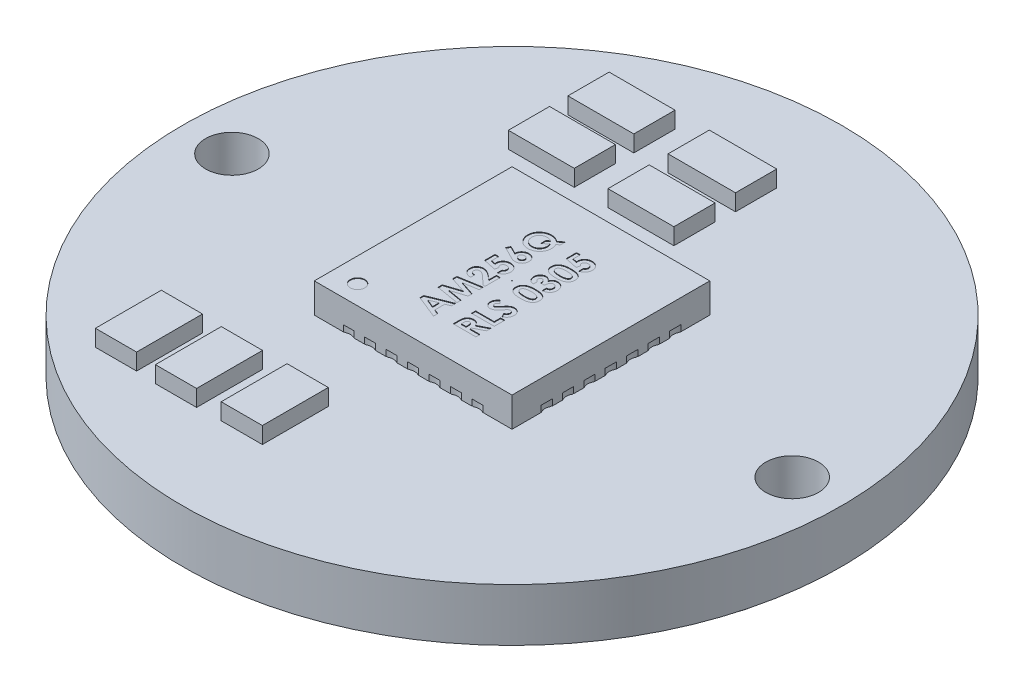
from build123d import *

# Parameters (mm, degrees)
SKETCH1_W           = 6
SKETCH1_H           = 6
SKETCH1_R           = 0.010623907
BASE_EXTRUDE_DEPTH  = 0.9
SKETCH2_W           = 4.4
SKETCH2_H           = 4.4
SKETCH2_R           = 0.005
SKETCH2_W_2         = 0.5
SKETCH2_H_2         = 0.3
SKETCH2_W_3         = 0.3
SKETCH2_H_3         = 0.5
SKETCH2_W_4         = 0.4
SKETCH2_H_4         = 0.4
BOSS_EXTRUDE1_DEPTH = 0.01
SKETCH3_R           = 0.3
CUT_EXTRUDE1_DEPTH  = 0.2
CUT_EXTRUDE2_DEPTH  = 0.02
SKETCH5_R           = 0.22
CUT_EXTRUDE3_DEPTH  = 0.02
SKETCH6_W           = 3
SKETCH6_H           = 3
CUT_EXTRUDE4_DEPTH  = 0.55
SKETCH7_W           = 4.4
SKETCH7_H           = 4.4
BOSS_EXTRUDE2_DEPTH = 0.3
SKETCH9_R           = 10
SKETCH9_R_2         = 0.8
BOSS_EXTRUDE3_DEPTH = 1.6
SKETCH11_R          = 0.8
SKETCH11_W          = 0.8
SKETCH11_H          = 2.5
BOSS_EXTRUDE5_DEPTH = 0.05
SKETCH12_W          = 2
SKETCH12_H          = 1.25
SKETCH12_W_2        = 2.04585674
SKETCH12_W_3        = 1.25
SKETCH12_H_2        = 2
BOSS_EXTRUDE6_DEPTH = 0.5
SKETCH13_W          = 1.25
SKETCH13_H          = 2
SKETCH13_W_2        = 2
SKETCH13_H_2        = 1.25
BOSS_EXTRUDE7_DEPTH = 0.5
SKETCH14_W          = 3
SKETCH14_H          = 1.5
BOSS_EXTRUDE8_DEPTH = 1.8
BOSS_EXTRUDE9_DEPTH = 1.6
SKETCH21_R          = 0.328315111
CUT_EXTRUDE9_DEPTH  = 0.01
SKETCH22_W          = 0.158417846
SKETCH22_H          = 1.779871103
CUT_EXTRUDE10_DEPTH = 0.01
CUT_EXTRUDE11_DEPTH = 8.6


with BuildPart() as part:
    # Sketch1 → Base-Extrude (new body)
    with BuildSketch(Plane(origin=(0, 0, 0), x_dir=(1, 0, 0), z_dir=(0, 1, 0))):
        with Locations((3, 3)):
            Rectangle(SKETCH1_W, SKETCH1_H)
        with Locations((3, 3)):
            Circle(SKETCH1_R, mode=Mode.SUBTRACT)
    extrude(amount=BASE_EXTRUDE_DEPTH)

    # Sketch2 → Boss-Extrude1 (add)
    # profile 1 of 30: a face of its own
    with BuildSketch(Plane.XZ):
        with Locations((3.000818474, -3)):
            Rectangle(SKETCH2_W, SKETCH2_H)
        with Locations((3, -3)):
            Circle(SKETCH2_R, mode=Mode.SUBTRACT)
    # profile 2 of 30: a face of its own
    with BuildSketch(Plane.XZ):
        with Locations((0.250818474, -3.65)):
            Rectangle(SKETCH2_W_2, SKETCH2_H_2)
    # profile 3 of 30: a face of its own
    with BuildSketch(Plane.XZ):
        with Locations((1.700818474, -5.75)):
            Rectangle(SKETCH2_W_3, SKETCH2_H_3)
    # profile 4 of 30: a face of its own
    with BuildSketch(Plane.XZ):
        with Locations((1.050818474, -5.75)):
            Rectangle(SKETCH2_W_3, SKETCH2_H_3)
    # profile 5 of 30: a face of its own
    with BuildSketch(Plane.XZ):
        with Locations((0.250818474, -4.95)):
            Rectangle(SKETCH2_W_2, SKETCH2_H_2)
    # profile 6 of 30: a face of its own
    with BuildSketch(Plane.XZ):
        with Locations((0.250818474, -4.3)):
            Rectangle(SKETCH2_W_2, SKETCH2_H_2)
    # profile 7 of 30: a face of its own
    with BuildSketch(Plane.XZ):
        with Locations((5.67, -0.316672936)):
            Rectangle(SKETCH2_W_4, SKETCH2_H_4)
    # profile 8 of 30: a face of its own
    with BuildSketch(Plane.XZ):
        with Locations((1.050818474, -0.25)):
            Rectangle(SKETCH2_W_3, SKETCH2_H_3)
    # profile 9 of 30: a face of its own
    with BuildSketch(Plane.XZ):
        with Locations((1.700818474, -0.25)):
            Rectangle(SKETCH2_W_3, SKETCH2_H_3)
    # profile 10 of 30: a face of its own
    with BuildSketch(Plane.XZ):
        with Locations((0.250818474, -1.05)):
            Rectangle(SKETCH2_W_2, SKETCH2_H_2)
    # profile 11 of 30: a face of its own
    with BuildSketch(Plane.XZ):
        with Locations((0.250818474, -1.7)):
            Rectangle(SKETCH2_W_2, SKETCH2_H_2)
    # profile 12 of 30: a face of its own
    with BuildSketch(Plane.XZ):
        with Locations((0.250818474, -2.35)):
            Rectangle(SKETCH2_W_2, SKETCH2_H_2)
    # profile 13 of 30: a face of its own
    with BuildSketch(Plane.XZ):
        with Locations((0.250818474, -3)):
            Rectangle(SKETCH2_W_2, SKETCH2_H_2)
    # profile 14 of 30: a face of its own
    with BuildSketch(Plane.XZ):
        with Locations((5.750818474, -3.65)):
            Rectangle(SKETCH2_W_2, SKETCH2_H_2)
    # profile 15 of 30: a face of its own
    with BuildSketch(Plane.XZ):
        with Locations((5.750818474, -4.3)):
            Rectangle(SKETCH2_W_2, SKETCH2_H_2)
    # profile 16 of 30: a face of its own
    with BuildSketch(Plane.XZ):
        with Locations((5.750818474, -4.95)):
            Rectangle(SKETCH2_W_2, SKETCH2_H_2)
    # profile 17 of 30: a face of its own
    with BuildSketch(Plane.XZ):
        with Locations((3.650818474, -5.75)):
            Rectangle(SKETCH2_W_3, SKETCH2_H_3)
    # profile 18 of 30: a face of its own
    with BuildSketch(Plane.XZ):
        with Locations((4.300818474, -5.75)):
            Rectangle(SKETCH2_W_3, SKETCH2_H_3)
    # profile 19 of 30: a face of its own
    with BuildSketch(Plane.XZ):
        with Locations((4.950818474, -5.75)):
            Rectangle(SKETCH2_W_3, SKETCH2_H_3)
    # profile 20 of 30: a face of its own
    with BuildSketch(Plane.XZ):
        with Locations((3.000818474, -5.75)):
            Rectangle(SKETCH2_W_3, SKETCH2_H_3)
    # profile 21 of 30: a face of its own
    with BuildSketch(Plane.XZ):
        with Locations((2.350818474, -5.75)):
            Rectangle(SKETCH2_W_3, SKETCH2_H_3)
    # profile 22 of 30: a face of its own
    with BuildSketch(Plane.XZ):
        with Locations((5.750818474, -1.05)):
            Rectangle(SKETCH2_W_2, SKETCH2_H_2)
    # profile 23 of 30: a face of its own
    with BuildSketch(Plane.XZ):
        with Locations((5.750818474, -3)):
            Rectangle(SKETCH2_W_2, SKETCH2_H_2)
    # profile 24 of 30: a face of its own
    with BuildSketch(Plane.XZ):
        with Locations((5.750818474, -2.35)):
            Rectangle(SKETCH2_W_2, SKETCH2_H_2)
    # profile 25 of 30: a face of its own
    with BuildSketch(Plane.XZ):
        with Locations((5.750818474, -1.7)):
            Rectangle(SKETCH2_W_2, SKETCH2_H_2)
    # profile 26 of 30: a face of its own
    with BuildSketch(Plane.XZ):
        with Locations((2.350818474, -0.25)):
            Rectangle(SKETCH2_W_3, SKETCH2_H_3)
    # profile 27 of 30: a face of its own
    with BuildSketch(Plane.XZ):
        with Locations((4.950818474, -0.25)):
            Rectangle(SKETCH2_W_3, SKETCH2_H_3)
    # profile 28 of 30: a face of its own
    with BuildSketch(Plane.XZ):
        with Locations((4.300818474, -0.25)):
            Rectangle(SKETCH2_W_3, SKETCH2_H_3)
    # profile 29 of 30: a face of its own
    with BuildSketch(Plane.XZ):
        with Locations((3.650818474, -0.25)):
            Rectangle(SKETCH2_W_3, SKETCH2_H_3)
    # profile 30 of 30: a face of its own
    with BuildSketch(Plane.XZ):
        with Locations((3.000818474, -0.25)):
            Rectangle(SKETCH2_W_3, SKETCH2_H_3)
    extrude(amount=BOSS_EXTRUDE1_DEPTH)

    # Sketch3 → Cut-Extrude1 (cut)
    with BuildSketch(Plane.XZ.offset(0.01)):
        with Locations((4.945893691, 0.25)):
            Circle(SKETCH3_R)
        with Locations((4.295893691, 0.25)):
            Circle(SKETCH3_R)
        with Locations((3.645893691, 0.25)):
            Circle(SKETCH3_R)
        with Locations((2.995893691, 0.25)):
            Circle(SKETCH3_R)
        with Locations((2.345893691, 0.25)):
            Circle(SKETCH3_R)
        with Locations((1.695893691, 0.25)):
            Circle(SKETCH3_R)
        with Locations((1.045893691, 0.25)):
            Circle(SKETCH3_R)
        with Locations((4.945893691, -6.25)):
            Circle(SKETCH3_R)
        with Locations((4.295893691, -6.25)):
            Circle(SKETCH3_R)
        with Locations((3.645893691, -6.25)):
            Circle(SKETCH3_R)
        with Locations((2.995893691, -6.25)):
            Circle(SKETCH3_R)
        with Locations((2.345893691, -6.25)):
            Circle(SKETCH3_R)
        with Locations((1.695893691, -6.25)):
            Circle(SKETCH3_R)
        with Locations((1.045893691, -6.25)):
            Circle(SKETCH3_R)
        with Locations((-0.254106309, -1.05)):
            Circle(SKETCH3_R)
        with Locations((6.245893691, -1.7)):
            Circle(SKETCH3_R)
        with Locations((6.245893691, -1.05)):
            Circle(SKETCH3_R)
        with Locations((-0.254106309, -1.7)):
            Circle(SKETCH3_R)
        with Locations((6.245893691, -2.35)):
            Circle(SKETCH3_R)
        with Locations((-0.254106309, -2.35)):
            Circle(SKETCH3_R)
        with Locations((6.245893691, -3)):
            Circle(SKETCH3_R)
        with Locations((-0.254106309, -3)):
            Circle(SKETCH3_R)
        with Locations((6.245893691, -3.65)):
            Circle(SKETCH3_R)
        with Locations((-0.254106309, -3.65)):
            Circle(SKETCH3_R)
        with Locations((6.245893691, -4.3)):
            Circle(SKETCH3_R)
        with Locations((-0.254106309, -4.3)):
            Circle(SKETCH3_R)
        with Locations((6.245893691, -4.95)):
            Circle(SKETCH3_R)
        with Locations((-0.254106309, -4.95)):
            Circle(SKETCH3_R)
    extrude(amount=-CUT_EXTRUDE1_DEPTH, mode=Mode.SUBTRACT)

    # Sketch4 → Cut-Extrude2 (cut)
    # profile 1 of 13: a face of its own
    with BuildSketch(Plane(origin=(0, 0.9, 0), x_dir=(-1, 0, 0), z_dir=(0, 1, 0))):
        Polygon((-2.045639928, -1.161083643), (-2.045639928, -1.275598617), (-2.733556595, -1.553411117), (-2.733556595, -1.421532861), (-2.592445484, -1.368064979), (-2.592445484, -1.068341672), (-2.733556595, -1.01487379), (-2.733556595, -0.883133339), align=None)
        Polygon((-2.230159242, -1.218272228), (-2.468973261, -1.115194971), (-2.468973261, -1.321349485), align=None, mode=Mode.SUBTRACT)
    # profile 2 of 13: a face of its own
    with BuildSketch(Plane(origin=(0, 0.9, 0), x_dir=(-1, 0, 0), z_dir=(0, 1, 0))):
        Polygon((-2.045639928, -1.709267236), (-2.045639928, -1.837424788), (-2.525472827, -1.994383339), (-2.045639928, -2.15244432), (-2.045639928, -2.279361637), (-2.733556595, -2.395668061), (-2.733556595, -2.270679997), (-2.299061152, -2.197230561), (-2.733556595, -2.054190196), (-2.733556595, -1.933749658), (-2.299061152, -1.791536117), (-2.733556595, -1.718224485), (-2.733556595, -1.593098617), align=None)
    # profile 3 of 13: a face of its own
    with BuildSketch(Plane(origin=(0, 0.9, 0), x_dir=(-1, 0, 0), z_dir=(0, 1, 0))):
        with BuildLine():
            Line((-2.274945484, -2.589695839), (-2.274945484, -2.466223617))
            add(Edge.make_bspline(
                [(-2.274945484, -2.466223617), (-2.265605463, -2.466756874), (-2.247355624, -2.467798827), (-2.220847149, -2.471943454), (-2.195799554, -2.477497112), (-2.17230046, -2.484909206), (-2.150358405, -2.494222987), (-2.129898588, -2.505198787), (-2.111028729, -2.518117013), (-2.093839831, -2.532702723), (-2.078419511, -2.548708292), (-2.064746887, -2.565801428), (-2.053464582, -2.584243594), (-2.044180289, -2.603697836), (-2.036762571, -2.624160842), (-2.031803226, -2.645826224), (-2.028444709, -2.668506392), (-2.028150825, -2.684032803), (-2.028001039, -2.691946273)],
                knots=[0, 0, 0, 0, 1.199038563, 2.342849363, 3.436047546, 4.486744587, 5.497670872, 6.488682221, 7.459191391, 8.424610317, 9.374430501, 10.305433194, 11.225809216, 12.140057399, 13.06607119, 14.010487599, 14.985989317, 16, 16, 16, 16], degree=3))
            add(Edge.make_bspline(
                [(-2.028001039, -2.691946273), (-2.028304625, -2.701659732), (-2.028897296, -2.72062268), (-2.033937861, -2.748180929), (-2.042418421, -2.773942995), (-2.054149706, -2.797909676), (-2.069122117, -2.819793274), (-2.087130599, -2.839451234), (-2.108112473, -2.856760775), (-2.131639816, -2.871390583), (-2.156591191, -2.883347384), (-2.182286901, -2.891898023), (-2.208191476, -2.897481022), (-2.225630122, -2.89807922), (-2.234293357, -2.898376394)],
                knots=[0, 0, 0, 0, 1.075208937, 2.099059817, 3.090102131, 4.070747506, 5.044426497, 6.016695572, 7.013986309, 8.047248753, 9.078128699, 10.07077592, 11.041593041, 12, 12, 12, 12], degree=3))
            add(Edge.make_bspline(
                [(-2.234293357, -2.898376394), (-2.239533698, -2.898260982), (-2.250081211, -2.898028685), (-2.266042185, -2.896413496), (-2.282300305, -2.893990394), (-2.298841626, -2.890336942), (-2.315670799, -2.885780804), (-2.332838137, -2.88025349), (-2.350246501, -2.87362707), (-2.368091064, -2.866011031), (-2.386432781, -2.856928741), (-2.405534142, -2.846338606), (-2.425451439, -2.834021201), (-2.446039125, -2.81984281), (-2.467743448, -2.804378868), (-2.490005599, -2.78689597), (-2.513190194, -2.767905884), (-2.528677801, -2.754413337), (-2.536634937, -2.747481212)],
                knots=[0, 0, 0, 0, 0.728291422, 1.465870735, 2.227967504, 3.011895603, 3.818808047, 4.650669213, 5.517493715, 6.406970765, 7.346374078, 8.360901659, 9.441709605, 10.599840149, 11.834858619, 13.145178554, 14.533265854, 16, 16, 16, 16], degree=3))
            Line((-2.536634937, -2.747481212), (-2.618903817, -2.675685422))
            Line((-2.618903817, -2.675685422), (-2.618903817, -2.907195839))
            Line((-2.618903817, -2.907195839), (-2.733556595, -2.907195839))
            Line((-2.733556595, -2.907195839), (-2.733556595, -2.448584728))
            Line((-2.733556595, -2.448584728), (-2.670993661, -2.448584728))
            Line((-2.670993661, -2.448584728), (-2.454228253, -2.652258773))
            add(Edge.make_bspline(
                [(-2.454228253, -2.652258773), (-2.447905138, -2.65815566), (-2.435659141, -2.669576181), (-2.417674592, -2.685826406), (-2.400607683, -2.700531424), (-2.384276688, -2.713386315), (-2.369211317, -2.725065687), (-2.354957481, -2.735048757), (-2.34164404, -2.743426863), (-2.325590356, -2.752522485), (-2.30644348, -2.761160336), (-2.284385494, -2.769086087), (-2.26330314, -2.773917381), (-2.249565425, -2.774584252), (-2.242974997, -2.774904172)],
                knots=[0, 0, 0, 0, 1.246127091, 2.413378631, 3.493388633, 4.492180848, 5.408488754, 6.240484944, 6.999099869, 7.674939598, 8.898438119, 10.020720584, 11.050475521, 12, 12, 12, 12], degree=3))
            add(Edge.make_bspline(
                [(-2.242974997, -2.774904172), (-2.236597371, -2.774668711), (-2.224239696, -2.774212467), (-2.206712112, -2.769073744), (-2.190722246, -2.761384943), (-2.176998481, -2.750222263), (-2.165622756, -2.736749194), (-2.157286762, -2.721091248), (-2.152387303, -2.703535919), (-2.151783749, -2.691242449), (-2.151473261, -2.684918278)],
                knots=[0, 0, 0, 0, 1.061596218, 2.057012874, 3.024113775, 4.006148568, 4.986025304, 5.949989669, 6.945406325, 8, 8, 8, 8], degree=3))
            add(Edge.make_bspline(
                [(-2.151473261, -2.684918278), (-2.151588796, -2.681651775), (-2.151816244, -2.67522114), (-2.153330307, -2.665768608), (-2.155998683, -2.656773845), (-2.159573933, -2.648136734), (-2.164312952, -2.639949452), (-2.170154547, -2.632232651), (-2.176950271, -2.624905024), (-2.184678875, -2.618000179), (-2.193303999, -2.611715868), (-2.20274687, -2.606134166), (-2.213001627, -2.601519028), (-2.223932892, -2.597455693), (-2.235658075, -2.594321854), (-2.248107002, -2.592040031), (-2.26125942, -2.590305313), (-2.270300471, -2.589902693), (-2.274945484, -2.589695839)],
                knots=[0, 0, 0, 0, 0.903469896, 1.778625579, 2.63899355, 3.493148037, 4.358286772, 5.247621495, 6.164656832, 7.118446693, 8.109501108, 9.111810964, 10.146451449, 11.215617525, 12.33435995, 13.498009769, 14.714554818, 16, 16, 16, 16], degree=3))
        make_face()
    # profile 4 of 13: a face of its own
    with BuildSketch(Plane(origin=(0, 0.9, 0), x_dir=(-1, 0, 0), z_dir=(0, 1, 0))):
        with BuildLine():
            Line((-2.045639928, -3.123134424), (-2.045639928, -3.436362505))
            Line((-2.045639928, -3.436362505), (-2.160292706, -3.436362505))
            Line((-2.160292706, -3.436362505), (-2.160292706, -3.220975136))
            Line((-2.160292706, -3.220975136), (-2.290379511, -3.194103391))
            add(Edge.make_bspline(
                [(-2.290379511, -3.194103391), (-2.289356663, -3.197764525), (-2.287327244, -3.20502853), (-2.285359638, -3.21591626), (-2.284014387, -3.226453925), (-2.283846785, -3.233327628), (-2.283764928, -3.236684771)],
                knots=[0, 0, 0, 0, 1.054652254, 2.092520994, 3.068380062, 4, 4, 4, 4], degree=3))
            add(Edge.make_bspline(
                [(-2.283764928, -3.236684771), (-2.283932542, -3.243999554), (-2.284262946, -3.258418601), (-2.287399559, -3.279511839), (-2.292339629, -3.29970986), (-2.299385189, -3.318950856), (-2.308555166, -3.337216031), (-2.319648268, -3.354527527), (-2.332683979, -3.370906591), (-2.347670459, -3.38606226), (-2.364125953, -3.399987923), (-2.381924312, -3.412095492), (-2.400811747, -3.422436111), (-2.420905663, -3.430660683), (-2.442079856, -3.437152215), (-2.464347896, -3.441843142), (-2.487736173, -3.444617121), (-2.503692322, -3.444991175), (-2.511830249, -3.44518195)],
                knots=[0, 0, 0, 0, 1.01440847, 1.999622559, 2.951875003, 3.895578053, 4.836219714, 5.782137149, 6.743708247, 7.735272588, 8.734977101, 9.730283169, 10.717124674, 11.717316708, 12.737475749, 13.78628267, 14.87096371, 16, 16, 16, 16], degree=3))
            add(Edge.make_bspline(
                [(-2.511830249, -3.44518195), (-2.520061062, -3.444950204), (-2.536302861, -3.444492901), (-2.560175411, -3.441471751), (-2.583087453, -3.436243689), (-2.604911141, -3.428701321), (-2.625832494, -3.419372219), (-2.645709872, -3.407783947), (-2.664600919, -3.394136744), (-2.682247535, -3.378462037), (-2.698379518, -3.361428631), (-2.712570175, -3.343290232), (-2.724511668, -3.32417647), (-2.73416237, -3.304086314), (-2.741797845, -3.283135176), (-2.747356104, -3.261316657), (-2.750543457, -3.238524733), (-2.750975753, -3.223051978), (-2.751195484, -3.215187375)],
                knots=[0, 0, 0, 0, 1.06812338, 2.107719657, 3.117068656, 4.112431602, 5.099639003, 6.085279307, 7.092884053, 8.119131772, 9.143854758, 10.133578715, 11.102895672, 12.062725997, 13.020721913, 13.992309192, 14.979516593, 16, 16, 16, 16], degree=3))
            add(Edge.make_bspline(
                [(-2.751195484, -3.215187375), (-2.75101573, -3.208154295), (-2.750661219, -3.19428359), (-2.748482206, -3.17385265), (-2.744629691, -3.154154955), (-2.739054104, -3.135295078), (-2.732191829, -3.117074582), (-2.723609258, -3.099704102), (-2.713469813, -3.083088182), (-2.701958541, -3.067274006), (-2.688991539, -3.052518533), (-2.674796922, -3.0390513), (-2.659553604, -3.026790776), (-2.643073532, -3.015999316), (-2.625381051, -3.006710748), (-2.606684673, -2.998473457), (-2.586789148, -2.991731152), (-2.572996465, -2.988309627), (-2.56598715, -2.986570839)],
                knots=[0, 0, 0, 0, 1.054957082, 2.080596141, 3.077793124, 4.061112343, 5.027190972, 5.994718051, 6.962465889, 7.943658696, 8.924948258, 9.904494768, 10.875059, 11.855380583, 12.854004648, 13.869083016, 14.917087635, 16, 16, 16, 16], degree=3))
            Line((-2.56598715, -2.986570839), (-2.56598715, -3.12768195))
            add(Edge.make_bspline(
                [(-2.56598715, -3.12768195), (-2.570844893, -3.130261026), (-2.580285363, -3.135273167), (-2.592809618, -3.144815024), (-2.603551116, -3.155494027), (-2.61241078, -3.16732459), (-2.619122458, -3.180138559), (-2.624259158, -3.193506627), (-2.627166372, -3.207666892), (-2.627536405, -3.21733384), (-2.627723261, -3.22221537)],
                knots=[0, 0, 0, 0, 1.105084364, 2.147605349, 3.154024051, 4.144789344, 5.108147638, 6.055727127, 7.018198351, 8, 8, 8, 8], degree=3))
            add(Edge.make_bspline(
                [(-2.627723261, -3.22221537), (-2.627595195, -3.225618037), (-2.627343223, -3.232312841), (-2.62601124, -3.242177038), (-2.623485218, -3.251591064), (-2.619998289, -3.260633391), (-2.615591962, -3.269330855), (-2.610178032, -3.277639645), (-2.603790559, -3.285518117), (-2.596532986, -3.292940018), (-2.588421388, -3.299639003), (-2.579762247, -3.30556464), (-2.570563106, -3.310633661), (-2.560722544, -3.314573802), (-2.550349953, -3.317753379), (-2.539432273, -3.320108762), (-2.527944412, -3.321513046), (-2.520102451, -3.321643289), (-2.516102168, -3.321709728)],
                knots=[0, 0, 0, 0, 0.978584799, 1.925382083, 2.854237347, 3.773848163, 4.706917643, 5.651871472, 6.619075428, 7.618203006, 8.630937754, 9.638147826, 10.630884984, 11.643619732, 12.679505692, 13.746568031, 14.850495961, 16, 16, 16, 16], degree=3))
            add(Edge.make_bspline(
                [(-2.516102168, -3.321709728), (-2.512191757, -3.321653975), (-2.504574627, -3.321545374), (-2.493450897, -3.320009109), (-2.48280204, -3.318084047), (-2.472727697, -3.314972119), (-2.463115335, -3.311175338), (-2.454187853, -3.306211742), (-2.445536097, -3.300823725), (-2.437787863, -3.294261894), (-2.430619522, -3.28732624), (-2.424361153, -3.279854348), (-2.41916443, -3.27193814), (-2.414628266, -3.263817309), (-2.41132678, -3.255169345), (-2.40905321, -3.24618828), (-2.407384944, -3.236883673), (-2.407286928, -3.230537198), (-2.40723715, -3.227314111)],
                knots=[0, 0, 0, 0, 1.166407123, 2.272056916, 3.347877023, 4.393466184, 5.414668253, 6.42708463, 7.438943561, 8.452102724, 9.450960385, 10.414941083, 11.35441816, 12.274885341, 13.186627518, 14.108013686, 15.039145946, 16, 16, 16, 16], degree=3))
            add(Edge.make_bspline(
                [(-2.40723715, -3.227314111), (-2.407369995, -3.22381309), (-2.407636243, -3.216796293), (-2.409802636, -3.206371089), (-2.413308672, -3.196071584), (-2.418145804, -3.185840502), (-2.424476084, -3.175779404), (-2.431900776, -3.165622774), (-2.440959356, -3.155710575), (-2.447706206, -3.149408122), (-2.451196569, -3.146147662)],
                knots=[0, 0, 0, 0, 0.88288272, 1.769486374, 2.674910571, 3.623812639, 4.617874466, 5.670434592, 6.794841017, 8, 8, 8, 8], degree=3))
            Line((-2.451196569, -3.146147662), (-2.427356508, -3.042243582))
            Line((-2.427356508, -3.042243582), (-2.045639928, -3.123134424))
        make_face()
    # profile 5 of 13: a face of its own
    with BuildSketch(Plane(origin=(0, 0.9, 0), x_dir=(-1, 0, 0), z_dir=(0, 1, 0))):
        with BuildLine():
            Line((-2.028001039, -3.777564762), (-2.083398175, -3.886843191))
            Line((-2.083398175, -3.886843191), (-2.319042706, -3.766953868))
            add(Edge.make_bspline(
                [(-2.319042706, -3.766953868), (-2.319226087, -3.774036817), (-2.319587286, -3.787987846), (-2.322506558, -3.808513954), (-2.32755328, -3.828137296), (-2.334242696, -3.847055732), (-2.343226647, -3.865038003), (-2.353913527, -3.882373724), (-2.366947326, -3.898614409), (-2.381388083, -3.914132445), (-2.397386367, -3.928242915), (-2.414577032, -3.940500353), (-2.432541826, -3.951182494), (-2.451682665, -3.95948636), (-2.471682269, -3.966184535), (-2.492620583, -3.971017563), (-2.514558242, -3.973774941), (-2.529461488, -3.974155092), (-2.537048348, -3.974348617)],
                knots=[0, 0, 0, 0, 1.013260694, 1.995783107, 2.958651975, 3.908806537, 4.861209129, 5.829647963, 6.817170299, 7.835534541, 8.860094905, 9.863329007, 10.853101798, 11.844815043, 12.84250023, 13.867713965, 14.914507806, 16, 16, 16, 16], degree=3))
            add(Edge.make_bspline(
                [(-2.537048348, -3.974348617), (-2.544361584, -3.974167204), (-2.558816715, -3.97380863), (-2.580048277, -3.970846492), (-2.600416215, -3.966054687), (-2.619891611, -3.959223282), (-2.638504732, -3.95048851), (-2.656432624, -3.940038663), (-2.673279787, -3.927339524), (-2.689131905, -3.912980995), (-2.70363508, -3.897269787), (-2.716386583, -3.880600618), (-2.727045697, -3.863050355), (-2.735997365, -3.84484426), (-2.742685499, -3.825653315), (-2.747731646, -3.805754833), (-2.750643994, -3.785000589), (-2.751010183, -3.77091304), (-2.751195484, -3.76378438)],
                knots=[0, 0, 0, 0, 1.049811581, 2.075027318, 3.071773918, 4.050170609, 5.032849337, 6.020452587, 7.024397577, 8.056465645, 9.088112048, 10.090756029, 11.064784855, 12.032427273, 12.998382039, 13.977467781, 14.976547025, 16, 16, 16, 16], degree=3))
            add(Edge.make_bspline(
                [(-2.751195484, -3.76378438), (-2.751043408, -3.756329978), (-2.750744371, -3.741671903), (-2.747395951, -3.720223472), (-2.742355372, -3.69965258), (-2.735158281, -3.68007484), (-2.725994151, -3.661368503), (-2.714654461, -3.643753803), (-2.701264259, -3.62708236), (-2.686124802, -3.611531916), (-2.669541599, -3.597522125), (-2.652323916, -3.585026563), (-2.634444736, -3.574455301), (-2.615923174, -3.56589811), (-2.596818251, -3.559221592), (-2.577093707, -3.554576097), (-2.556801861, -3.551549128), (-2.543030665, -3.551194285), (-2.536083721, -3.551015283)],
                knots=[0, 0, 0, 0, 1.063775006, 2.091769615, 3.092589432, 4.084662827, 5.064601646, 6.061867366, 7.070035304, 8.113879863, 9.156342271, 10.166834137, 11.149076039, 12.117706134, 13.076241869, 14.034148791, 15.008317125, 16, 16, 16, 16], degree=3))
            add(Edge.make_bspline(
                [(-2.536083721, -3.551015283), (-2.530704126, -3.551109864), (-2.51991499, -3.551299553), (-2.503758845, -3.553205815), (-2.487560292, -3.556104001), (-2.473891439, -3.559463379), (-2.462332994, -3.562922526), (-2.452551395, -3.566404185), (-2.441695958, -3.570718934), (-2.429738964, -3.575651331), (-2.416694796, -3.581356482), (-2.40259901, -3.587804584), (-2.387344862, -3.595011691), (-2.376867624, -3.600151351), (-2.371408157, -3.602829519)],
                knots=[0, 0, 0, 0, 1.110454016, 2.227089276, 3.35462975, 4.507227546, 5.131400587, 5.845402449, 6.650387134, 7.543487832, 8.516250726, 9.590168902, 10.744287919, 12, 12, 12, 12], degree=3))
            Line((-2.371408157, -3.602829519), (-2.028001039, -3.777564762))
        make_face()
        with BuildLine():
            add(Edge.make_bspline(
                [(-2.433695484, -3.761028304), (-2.433967231, -3.755103731), (-2.434499006, -3.743510119), (-2.440068007, -3.727025737), (-2.448804384, -3.711995721), (-2.460971478, -3.698967517), (-2.475511633, -3.688070623), (-2.492096623, -3.680063203), (-2.510505124, -3.675246295), (-2.523376041, -3.674745849), (-2.530020353, -3.674487505)],
                knots=[0, 0, 0, 0, 0.981744412, 1.921144944, 2.858899012, 3.85339082, 4.86292663, 5.863643845, 6.897155691, 8, 8, 8, 8], degree=3))
            add(Edge.make_bspline(
                [(-2.530020353, -3.674487505), (-2.536665256, -3.674796864), (-2.549590034, -3.675398586), (-2.568216142, -3.680353587), (-2.585109919, -3.688731176), (-2.599826791, -3.700174189), (-2.612143779, -3.713529367), (-2.621140811, -3.728464913), (-2.626704331, -3.744616928), (-2.627381273, -3.755794728), (-2.627723261, -3.761441715)],
                knots=[0, 0, 0, 0, 1.098593804, 2.136838383, 3.163662877, 4.199231707, 5.205701886, 6.153612227, 7.067210972, 8, 8, 8, 8], degree=3))
            add(Edge.make_bspline(
                [(-2.627723261, -3.761441715), (-2.627374675, -3.767405135), (-2.626691038, -3.779100438), (-2.621368666, -3.795971679), (-2.61247596, -3.811383658), (-2.600285712, -3.825010829), (-2.585720989, -3.836716311), (-2.568659744, -3.844815321), (-2.54994183, -3.850044412), (-2.536809731, -3.850592849), (-2.530020353, -3.850876394)],
                knots=[0, 0, 0, 0, 0.96921794, 1.900804717, 2.848419905, 3.844199796, 4.861108892, 5.867439427, 6.897452859, 8, 8, 8, 8], degree=3))
            add(Edge.make_bspline(
                [(-2.530020353, -3.850876394), (-2.523373831, -3.85057297), (-2.510490349, -3.849984818), (-2.492088031, -3.84501634), (-2.475462099, -3.83688269), (-2.460924268, -3.825679023), (-2.448697946, -3.812205884), (-2.440068122, -3.796510561), (-2.4344832, -3.779316037), (-2.433962525, -3.767227979), (-2.433695484, -3.761028304)],
                knots=[0, 0, 0, 0, 1.083506644, 2.10024676, 3.086160022, 4.086481818, 5.079696241, 6.033050226, 6.991198733, 8, 8, 8, 8], degree=3))
        make_face(mode=Mode.SUBTRACT)
    # profile 6 of 13: a face of its own
    with BuildSketch(Plane(origin=(0, 0.9, 0), x_dir=(-1, 0, 0), z_dir=(0, 1, 0))):
        with BuildLine():
            Line((-2.635578079, -4.71518195), (-2.786473261, -4.831901785))
            Line((-2.786473261, -4.831901785), (-2.786473261, -4.678250526))
            Line((-2.786473261, -4.678250526), (-2.708338496, -4.61775465))
            add(Edge.make_bspline(
                [(-2.708338496, -4.61775465), (-2.711788921, -4.61141789), (-2.718673495, -4.598774261), (-2.727258505, -4.578947384), (-2.734789902, -4.558753475), (-2.740691501, -4.537899919), (-2.745336776, -4.516586929), (-2.74888352, -4.494704073), (-2.750753639, -4.472267009), (-2.751047467, -4.457124357), (-2.751195484, -4.449496186)],
                knots=[0, 0, 0, 0, 0.985706899, 1.966764212, 2.949968678, 3.929638882, 4.925906056, 5.930211904, 6.957336097, 8, 8, 8, 8], degree=3))
            add(Edge.make_bspline(
                [(-2.751195484, -4.449496186), (-2.750910483, -4.436798456), (-2.75035149, -4.411893458), (-2.744984063, -4.375419432), (-2.736880708, -4.340502915), (-2.72504129, -4.307273516), (-2.70999603, -4.275619289), (-2.691351026, -4.245793284), (-2.66962322, -4.217448572), (-2.644599369, -4.191278642), (-2.617481372, -4.167333563), (-2.588670548, -4.14641129), (-2.558616408, -4.128625983), (-2.527271806, -4.114121563), (-2.494582706, -4.102842902), (-2.46063839, -4.094944545), (-2.42539195, -4.089937113), (-2.401466337, -4.089316429), (-2.389322654, -4.089001394)],
                knots=[0, 0, 0, 0, 1.070144486, 2.098953612, 3.10240755, 4.088674545, 5.067611437, 6.052256776, 7.0494179, 8.074208254, 9.100739571, 10.09639475, 11.072322686, 12.041159829, 13.004031207, 13.983083054, 14.976293755, 16, 16, 16, 16], degree=3))
            add(Edge.make_bspline(
                [(-2.389322654, -4.089001394), (-2.381186005, -4.089107834), (-2.365015735, -4.089319367), (-2.341045623, -4.091808719), (-2.317579209, -4.095506407), (-2.294608407, -4.100538539), (-2.272214253, -4.107376468), (-2.250316772, -4.115648317), (-2.228858158, -4.12533721), (-2.207969807, -4.136423613), (-2.187969941, -4.149024069), (-2.168696873, -4.162411865), (-2.150770996, -4.177304728), (-2.133785042, -4.193172522), (-2.117762826, -4.210076528), (-2.102963764, -4.228278105), (-2.089229308, -4.247533446), (-2.076550147, -4.267769399), (-2.065202415, -4.288719087), (-2.05516996, -4.310176889), (-2.046827347, -4.332074588), (-2.039822728, -4.354318068), (-2.034682216, -4.377016849), (-2.030733003, -4.400002353), (-2.028542184, -4.423454798), (-2.028182591, -4.439202683), (-2.028001039, -4.447153521)],
                knots=[0, 0, 0, 0, 1.035868537, 2.058620603, 3.065590905, 4.060526227, 5.050634247, 6.044812545, 7.039747867, 8.04732973, 9.05375611, 10.048691431, 11.033670581, 12.018736589, 13.007807122, 13.997310075, 15.003787459, 16.018274591, 17.036549742, 18.036357517, 19.032616246, 20.018845414, 21.003668199, 21.994260009, 22.987336151, 24, 24, 24, 24], degree=3))
            add(Edge.make_bspline(
                [(-2.028001039, -4.447153521), (-2.028306348, -4.459160638), (-2.028907959, -4.482820682), (-2.03405259, -4.517624329), (-2.042247101, -4.551187451), (-2.054089309, -4.583369347), (-2.069010865, -4.614375329), (-2.087530734, -4.643894813), (-2.109082372, -4.672329705), (-2.133884027, -4.698894888), (-2.160943507, -4.723253583), (-2.189689502, -4.744802849), (-2.220002453, -4.762912595), (-2.251784942, -4.777814805), (-2.28507059, -4.789228994), (-2.319789535, -4.797333901), (-2.355912325, -4.802476042), (-2.380531647, -4.803073011), (-2.393043357, -4.803376394)],
                knots=[0, 0, 0, 0, 1.015478292, 2.001001716, 2.970040306, 3.933999346, 4.897009851, 5.876290467, 6.877507104, 7.911566017, 8.946369682, 9.954562579, 10.946388516, 11.928787807, 12.919455568, 13.917801478, 14.94181223, 16, 16, 16, 16], degree=3))
            add(Edge.make_bspline(
                [(-2.393043357, -4.803376394), (-2.40458627, -4.803123964), (-2.427288905, -4.802627483), (-2.460757298, -4.798326333), (-2.493016347, -4.791537291), (-2.524088975, -4.781786569), (-2.553941316, -4.769429729), (-2.582484497, -4.754033068), (-2.610057383, -4.736278776), (-2.62702877, -4.722249284), (-2.635578079, -4.71518195)],
                knots=[0, 0, 0, 0, 1.049646143, 2.064447078, 3.064298101, 4.044929938, 5.022708814, 5.998521441, 6.991758374, 8, 8, 8, 8], degree=3))
        make_face()
        with BuildLine():
            add(Edge.make_bspline(
                [(-2.530571569, -4.634153304), (-2.525302211, -4.637828684), (-2.514884898, -4.645094767), (-2.498361622, -4.654288707), (-2.481516398, -4.662186405), (-2.46426083, -4.668717493), (-2.446496031, -4.673685683), (-2.428337976, -4.677216961), (-2.409778347, -4.679555437), (-2.397276421, -4.679787319), (-2.3909763, -4.679904172)],
                knots=[0, 0, 0, 0, 1.031533623, 2.039301536, 3.033003023, 4.018477747, 4.999688364, 5.992485227, 6.988348989, 8, 8, 8, 8], degree=3))
            add(Edge.make_bspline(
                [(-2.3909763, -4.679904172), (-2.382789982, -4.67968669), (-2.366676463, -4.67925861), (-2.342989354, -4.676043384), (-2.320288548, -4.670657046), (-2.298518482, -4.663146607), (-2.277623272, -4.653688397), (-2.257776909, -4.641806888), (-2.238876312, -4.627847675), (-2.221103503, -4.61194551), (-2.204837448, -4.594632228), (-2.190511833, -4.576219131), (-2.178426165, -4.556832528), (-2.168667777, -4.536461077), (-2.160808088, -4.515325761), (-2.155532625, -4.493199764), (-2.152073673, -4.470275939), (-2.151675142, -4.454653713), (-2.151473261, -4.44674011)],
                knots=[0, 0, 0, 0, 1.056263418, 2.079093448, 3.078410197, 4.062632158, 5.04680056, 6.032966551, 7.041959893, 8.074807684, 9.106532056, 10.103754224, 11.080880922, 12.048629763, 13.014470275, 13.984975, 14.979267944, 16, 16, 16, 16], degree=3))
            add(Edge.make_bspline(
                [(-2.151473261, -4.44674011), (-2.151686269, -4.438598637), (-2.152105513, -4.422574476), (-2.155382741, -4.399049618), (-2.160523217, -4.376484337), (-2.168070662, -4.354997124), (-2.177580868, -4.334523367), (-2.189249113, -4.315062336), (-2.203145158, -4.296717897), (-2.218845117, -4.279422127), (-2.236338359, -4.263847483), (-2.254892609, -4.249851257), (-2.274940373, -4.238532921), (-2.295824974, -4.228801272), (-2.318073584, -4.221612824), (-2.341325373, -4.216139603), (-2.365818964, -4.213158519), (-2.38247105, -4.21270517), (-2.3909763, -4.212473617)],
                knots=[0, 0, 0, 0, 1.042541523, 2.051944785, 3.036764563, 4.002557016, 4.96338965, 5.924060121, 6.903168093, 7.906930457, 8.911106644, 9.899645915, 10.877621684, 11.854481659, 12.84623786, 13.866778503, 14.910431946, 16, 16, 16, 16], degree=3))
            add(Edge.make_bspline(
                [(-2.3909763, -4.212473617), (-2.400405551, -4.212752992), (-2.418885322, -4.213300522), (-2.445842379, -4.217154723), (-2.471303417, -4.223744281), (-2.495130976, -4.233275236), (-2.517660541, -4.245052932), (-2.538412274, -4.259890817), (-2.557796483, -4.27714455), (-2.569079814, -4.290463182), (-2.574806595, -4.297222965)],
                knots=[0, 0, 0, 0, 1.078047314, 2.112794111, 3.106520711, 4.077995885, 5.041371964, 6.006121678, 6.988020189, 8, 8, 8, 8], degree=3))
            add(Edge.make_bspline(
                [(-2.574806595, -4.297222965), (-2.579045398, -4.302753934), (-2.587451303, -4.313722312), (-2.598099501, -4.331289508), (-2.607298933, -4.349269219), (-2.614789008, -4.367848751), (-2.620577346, -4.387040324), (-2.624683653, -4.406775795), (-2.627268455, -4.427057408), (-2.627570305, -4.440760816), (-2.627723261, -4.447704736)],
                knots=[0, 0, 0, 0, 1.027432533, 2.037485421, 3.025540779, 4.00463061, 4.988703594, 5.97891808, 6.97585834, 8, 8, 8, 8], degree=3))
            add(Edge.make_bspline(
                [(-2.627723261, -4.447704736), (-2.627469576, -4.455671966), (-2.626966057, -4.47148545), (-2.62257996, -4.494761493), (-2.616020452, -4.517439912), (-2.609315412, -4.531657485), (-2.605950258, -4.538793061)],
                knots=[0, 0, 0, 0, 1.010952568, 2.006554787, 2.999521277, 4, 4, 4, 4], degree=3))
            Line((-2.605950258, -4.538793061), (-2.451334372, -4.41931715))
            Line((-2.451334372, -4.41931715), (-2.451334372, -4.572968408))
            Line((-2.451334372, -4.572968408), (-2.530571569, -4.634153304))
        make_face(mode=Mode.SUBTRACT)
    # profile 7 of 13: a face of its own
    with BuildSketch(Plane(origin=(0, 0.9, 0), x_dir=(-1, 0, 0), z_dir=(0, 1, 0))):
        with BuildLine():
            Line((-3.236264928, -0.980147228), (-3.236264928, -1.124014415))
            add(Edge.make_bspline(
                [(-3.236264928, -1.124014415), (-3.236298578, -1.133524008), (-3.236363296, -1.151813633), (-3.237388895, -1.17818603), (-3.238809585, -1.202413564), (-3.24100415, -1.224573599), (-3.243841984, -1.244578456), (-3.247284854, -1.262470506), (-3.25117436, -1.278260138), (-3.255941552, -1.292160604), (-3.261431502, -1.304670477), (-3.267628077, -1.316298787), (-3.274765423, -1.327250506), (-3.282554341, -1.337726652), (-3.2912738, -1.347540232), (-3.30085314, -1.356664053), (-3.311223314, -1.365215432), (-3.322321962, -1.373205687), (-3.334133591, -1.380316101), (-3.346490486, -1.386615577), (-3.359426038, -1.391791189), (-3.372866193, -1.396100653), (-3.386827113, -1.399418677), (-3.401299735, -1.401671494), (-3.416290211, -1.403337245), (-3.426475247, -1.403432149), (-3.431670744, -1.403480561)],
                knots=[0, 0, 0, 0, 1.749037589, 3.363891962, 4.853828513, 6.212420965, 7.458679178, 8.568887289, 9.562757098, 10.447168552, 11.268163578, 12.073310924, 12.867792413, 13.67045336, 14.472446998, 15.279188696, 16.101356728, 16.943088626, 17.792208908, 18.634830833, 19.491484118, 20.351879174, 21.228996054, 22.12769993, 23.044919519, 24, 24, 24, 24], degree=3))
            add(Edge.make_bspline(
                [(-3.431670744, -1.403480561), (-3.437093544, -1.403353992), (-3.447726665, -1.403105813), (-3.463345854, -1.401768984), (-3.478289201, -1.399325682), (-3.492512954, -1.395624946), (-3.506194145, -1.39137143), (-3.519080347, -1.385715346), (-3.531358971, -1.379331895), (-3.542856331, -1.371750457), (-3.553827807, -1.3634302), (-3.56385304, -1.353753915), (-3.573470849, -1.343348478), (-3.582078808, -1.331628961), (-3.590258954, -1.319111972), (-3.597672346, -1.30554881), (-3.604505337, -1.291027994), (-3.608315885, -1.280819141), (-3.610264494, -1.275598617)],
                knots=[0, 0, 0, 0, 1.099860209, 2.156625411, 3.176576793, 4.16617041, 5.135385252, 6.078461593, 7.016046972, 7.938469504, 8.868247731, 9.803980173, 10.76021508, 11.73834243, 12.748633912, 13.790971185, 14.870363756, 16, 16, 16, 16], degree=3))
            Line((-3.610264494, -1.275598617), (-3.924181595, -1.434348617))
            Line((-3.924181595, -1.434348617), (-3.924181595, -1.297096012))
            Line((-3.924181595, -1.297096012), (-3.624320484, -1.145511811))
            Line((-3.624320484, -1.145511811), (-3.624320484, -1.10361945))
            Line((-3.624320484, -1.10361945), (-3.924181595, -1.10361945))
            Line((-3.924181595, -1.10361945), (-3.924181595, -0.980147228))
            Line((-3.924181595, -0.980147228), (-3.236264928, -0.980147228))
        make_face()
        with BuildLine():
            Line((-3.500848261, -1.10361945), (-3.500848261, -1.151712983))
            add(Edge.make_bspline(
                [(-3.500848261, -1.151712983), (-3.50078204, -1.157592818), (-3.500655239, -1.168851439), (-3.500067066, -1.185042799), (-3.498649931, -1.199748468), (-3.496859246, -1.213031371), (-3.494792228, -1.224959072), (-3.491828074, -1.235422863), (-3.488657695, -1.244591336), (-3.484698851, -1.252332848), (-3.480275955, -1.25897401), (-3.475029747, -1.264540661), (-3.469282804, -1.26944468), (-3.462673412, -1.273291434), (-3.455472355, -1.276399364), (-3.447544152, -1.278326802), (-3.439032354, -1.279856041), (-3.433102742, -1.279956212), (-3.430017098, -1.280008339)],
                knots=[0, 0, 0, 0, 1.688935225, 3.233948049, 4.651771667, 5.929878493, 7.083962697, 8.124219224, 9.050753627, 9.864999381, 10.615157594, 11.334035464, 12.05533055, 12.777108108, 13.522027315, 14.29964284, 15.115170198, 16, 16, 16, 16], degree=3))
            add(Edge.make_bspline(
                [(-3.430017098, -1.280008339), (-3.426371306, -1.279868293), (-3.419209824, -1.279593199), (-3.408899941, -1.276863258), (-3.399356892, -1.272518121), (-3.390626463, -1.266560895), (-3.382964873, -1.259063164), (-3.376266105, -1.250473467), (-3.370845638, -1.240665087), (-3.367374102, -1.231518613), (-3.365240272, -1.223139381), (-3.363725528, -1.215601972), (-3.362551055, -1.206849892), (-3.361414079, -1.196931977), (-3.36063147, -1.185805576), (-3.360077734, -1.173491238), (-3.35984797, -1.159982004), (-3.359775154, -1.150564635), (-3.35973715, -1.145649615)],
                knots=[0, 0, 0, 0, 1.020213939, 2.004021227, 2.966357326, 3.948562114, 4.950324333, 5.960000531, 6.991850424, 8.080015304, 8.69218159, 9.414443227, 10.233931419, 11.166782034, 12.212677862, 13.359889063, 14.622099264, 16, 16, 16, 16], degree=3))
            Line((-3.35973715, -1.145649615), (-3.35973715, -1.10361945))
            Line((-3.35973715, -1.10361945), (-3.500848261, -1.10361945))
        make_face(mode=Mode.SUBTRACT)
    # profile 8 of 13: a face of its own
    with BuildSketch(Plane(origin=(0, 0.9, 0), x_dir=(-1, 0, 0), z_dir=(0, 1, 0))):
        Polygon((-3.236264928, -1.535772228), (-3.236264928, -1.65924445), (-3.800709372, -1.65924445), (-3.800709372, -1.853272228), (-3.924181595, -1.853272228), (-3.924181595, -1.535772228), align=None)
    # profile 9 of 13: a face of its own
    with BuildSketch(Plane(origin=(0, 0.9, 0), x_dir=(-1, 0, 0), z_dir=(0, 1, 0))):
        with BuildLine():
            Line((-3.328180076, -2.311883339), (-3.412653817, -2.21955478))
            add(Edge.make_bspline(
                [(-3.412653817, -2.21955478), (-3.407073939, -2.215600581), (-3.39636135, -2.208009071), (-3.382032601, -2.195691657), (-3.369728924, -2.18344783), (-3.359802095, -2.171027254), (-3.351810684, -2.158643771), (-3.346298686, -2.146034289), (-3.342753888, -2.133343869), (-3.342314624, -2.124813388), (-3.342098261, -2.120611637)],
                knots=[0, 0, 0, 0, 1.299459705, 2.494781419, 3.587730629, 4.594196874, 5.512431013, 6.380462003, 7.202284646, 8, 8, 8, 8], degree=3))
            add(Edge.make_bspline(
                [(-3.342098261, -2.120611637), (-3.342235698, -2.116692694), (-3.342501053, -2.109126243), (-3.345138661, -2.098339706), (-3.349690785, -2.088763264), (-3.35564307, -2.080406265), (-3.362814194, -2.073786289), (-3.370334858, -2.068500751), (-3.378635971, -2.065524549), (-3.38433751, -2.065132822), (-3.38716011, -2.064938894)],
                knots=[0, 0, 0, 0, 1.185010067, 2.2879431, 3.333075148, 4.379039566, 5.372662701, 6.27520591, 7.14612461, 8, 8, 8, 8], degree=3))
            add(Edge.make_bspline(
                [(-3.38716011, -2.064938894), (-3.390023414, -2.065060419), (-3.395789708, -2.065305153), (-3.404240932, -2.067668952), (-3.412498761, -2.071231871), (-3.417525694, -2.074636385), (-3.420095223, -2.076376611)],
                knots=[0, 0, 0, 0, 0.967525499, 1.948461899, 2.951351359, 4, 4, 4, 4], degree=3))
            add(Edge.make_bspline(
                [(-3.420095223, -2.076376611), (-3.422092251, -2.077958896), (-3.426689145, -2.081601107), (-3.433976387, -2.088539649), (-3.442843654, -2.097265367), (-3.453242373, -2.107957466), (-3.465037066, -2.120602828), (-3.478296722, -2.135313369), (-3.493104569, -2.151881251), (-3.503430173, -2.163643878), (-3.508840883, -2.169807601)],
                knots=[0, 0, 0, 0, 0.473868417, 1.090782513, 1.870421581, 2.78911798, 3.865477667, 5.087766164, 6.473963263, 8, 8, 8, 8], degree=3))
            add(Edge.make_bspline(
                [(-3.508840883, -2.169807601), (-3.513848968, -2.175594287), (-3.523353273, -2.186576216), (-3.536843108, -2.202201319), (-3.548979584, -2.215933182), (-3.559580558, -2.227971848), (-3.568757258, -2.238134821), (-3.576553549, -2.246464827), (-3.582817652, -2.253063603), (-3.586601174, -2.25681462), (-3.588215883, -2.258415457)],
                knots=[0, 0, 0, 0, 1.543621617, 2.929473131, 4.163658386, 5.240097082, 6.164993805, 6.925417477, 7.541396219, 8, 8, 8, 8], degree=3))
            add(Edge.make_bspline(
                [(-3.588215883, -2.258415457), (-3.594786071, -2.264492159), (-3.60741628, -2.276173715), (-3.627047054, -2.291316603), (-3.646079302, -2.303969253), (-3.665097814, -2.313655128), (-3.684331028, -2.320745027), (-3.704110124, -2.325937831), (-3.724774589, -2.329004204), (-3.738871273, -2.329348225), (-3.746001256, -2.329522228)],
                knots=[0, 0, 0, 0, 1.20648512, 2.3192881, 3.339983362, 4.284774958, 5.190427137, 6.099526693, 7.038756749, 8, 8, 8, 8], degree=3))
            add(Edge.make_bspline(
                [(-3.746001256, -2.329522228), (-3.75294885, -2.329399006), (-3.766580287, -2.329157239), (-3.786528791, -2.326199273), (-3.805616836, -2.321975358), (-3.823653188, -2.315466799), (-3.840851632, -2.307467281), (-3.857217805, -2.297717749), (-3.872370173, -2.285798156), (-3.886715472, -2.272558274), (-3.899598044, -2.257687273), (-3.910932866, -2.241686563), (-3.920578449, -2.224586023), (-3.928217686, -2.206321854), (-3.934352052, -2.187005855), (-3.938711071, -2.166613609), (-3.941404704, -2.145121266), (-3.941679894, -2.130449752), (-3.941820484, -2.122954302)],
                knots=[0, 0, 0, 0, 1.043082113, 2.046565928, 3.024368146, 3.976196322, 4.921091788, 5.871642728, 6.831173094, 7.81279273, 8.801063391, 9.781590382, 10.755046466, 11.74476232, 12.751114423, 13.796272686, 14.874149815, 16, 16, 16, 16], degree=3))
            add(Edge.make_bspline(
                [(-3.941820484, -2.122954302), (-3.941716141, -2.117070781), (-3.941509482, -2.105418035), (-3.939821229, -2.088243893), (-3.937099189, -2.071659382), (-3.933188543, -2.055687533), (-3.928278537, -2.040281024), (-3.922168329, -2.025454176), (-3.914976543, -2.011222688), (-3.906699088, -1.997494924), (-3.897093304, -1.984365506), (-3.886358927, -1.971657918), (-3.874263269, -1.959530887), (-3.861042228, -1.947735686), (-3.846356981, -1.936689375), (-3.830631146, -1.925825566), (-3.813494012, -1.915670123), (-3.801474383, -1.909394396), (-3.795335024, -1.906188894)],
                knots=[0, 0, 0, 0, 1.016957334, 2.014158747, 2.980235577, 3.920141478, 4.854360818, 5.773095257, 6.689355356, 7.608638744, 8.541033765, 9.498850575, 10.481527934, 11.499755671, 12.559141621, 13.65604909, 14.802761907, 16, 16, 16, 16], degree=3))
            Line((-3.795335024, -1.906188894), (-3.730153817, -2.014778304))
            add(Edge.make_bspline(
                [(-3.730153817, -2.014778304), (-3.737123005, -2.018787642), (-3.750483534, -2.026473885), (-3.768435099, -2.039498942), (-3.783807643, -2.052842448), (-3.796329454, -2.066812893), (-3.806167967, -2.081240402), (-3.813199251, -2.096194662), (-3.817551608, -2.11168618), (-3.818083131, -2.122238299), (-3.818348261, -2.127501828)],
                knots=[0, 0, 0, 0, 1.283663364, 2.460892379, 3.537111102, 4.529833553, 5.449777664, 6.316464042, 7.160231139, 8, 8, 8, 8], degree=3))
            add(Edge.make_bspline(
                [(-3.818348261, -2.127501828), (-3.818133799, -2.132856577), (-3.81771771, -2.143245569), (-3.813798579, -2.158098939), (-3.80778323, -2.171776753), (-3.79903483, -2.1835362), (-3.789059109, -2.193522231), (-3.777808066, -2.200681189), (-3.765780841, -2.205324955), (-3.757388115, -2.205807375), (-3.753167055, -2.206050005)],
                knots=[0, 0, 0, 0, 1.13537643, 2.202795631, 3.242191317, 4.290390765, 5.297919085, 6.223733717, 7.106639842, 8, 8, 8, 8], degree=3))
            add(Edge.make_bspline(
                [(-3.753167055, -2.206050005), (-3.749242016, -2.205822897), (-3.741268675, -2.205361548), (-3.729406717, -2.201981885), (-3.717602278, -2.196654106), (-3.707817483, -2.190539854), (-3.699661449, -2.184165416), (-3.692700875, -2.177917247), (-3.68484976, -2.170512085), (-3.676322196, -2.161761244), (-3.666954224, -2.151834925), (-3.656768119, -2.140700633), (-3.645846912, -2.12823846), (-3.638407797, -2.119429818), (-3.634517966, -2.114823877)],
                knots=[0, 0, 0, 0, 0.916057066, 1.860882232, 2.859899639, 3.934694552, 4.546382938, 5.276161949, 6.118633209, 7.067046139, 8.129668089, 9.306861125, 10.591787583, 12, 12, 12, 12], degree=3))
            add(Edge.make_bspline(
                [(-3.634517966, -2.114823877), (-3.627109271, -2.106068135), (-3.612889742, -2.089263215), (-3.591892188, -2.065511375), (-3.572253142, -2.04412415), (-3.553816758, -2.025242393), (-3.536696778, -2.008815751), (-3.52105629, -1.994645263), (-3.50657799, -1.983039492), (-3.489400478, -1.970838924), (-3.468578483, -1.959060449), (-3.443393734, -1.949070106), (-3.418265866, -1.942552205), (-3.401391241, -1.94182473), (-3.393085675, -1.941466672)],
                knots=[0, 0, 0, 0, 1.34561873, 2.582649632, 3.719171478, 4.751946187, 5.678152813, 6.502542634, 7.227205346, 7.853698961, 8.973370308, 10.023159194, 11.027013428, 12, 12, 12, 12], degree=3))
            add(Edge.make_bspline(
                [(-3.393085675, -1.941466672), (-3.387196214, -1.941616131), (-3.375593345, -1.94191058), (-3.358531062, -1.944529427), (-3.342074994, -1.948461382), (-3.326230153, -1.95411263), (-3.311171885, -1.961689615), (-3.296668466, -1.970650045), (-3.282745167, -1.981178876), (-3.269855972, -1.993399551), (-3.257882567, -2.006656746), (-3.247372615, -2.020855859), (-3.238533517, -2.035848627), (-3.231093476, -2.051528996), (-3.2254942, -2.068098472), (-3.221489742, -2.085406469), (-3.219114264, -2.103457974), (-3.218790808, -2.115735482), (-3.218626039, -2.121989676)],
                knots=[0, 0, 0, 0, 1.010961173, 1.991702108, 2.958025473, 3.913824419, 4.873522744, 5.847800578, 6.838738273, 7.865764422, 8.893759806, 9.903642949, 10.894078012, 11.878777586, 12.879248405, 13.891624672, 14.925988217, 16, 16, 16, 16], degree=3))
            add(Edge.make_bspline(
                [(-3.218626039, -2.121989676), (-3.218923345, -2.130094481), (-3.21951561, -2.146240114), (-3.224122553, -2.170119078), (-3.231444486, -2.193454076), (-3.240067541, -2.212317559), (-3.248691271, -2.227194295), (-3.256457297, -2.238634178), (-3.265409531, -2.250297573), (-3.275583652, -2.262244586), (-3.286911712, -2.274414505), (-3.29962407, -2.286704928), (-3.313306352, -2.299415252), (-3.323135313, -2.307654503), (-3.328180076, -2.311883339)],
                knots=[0, 0, 0, 0, 1.282867522, 2.555608537, 3.83715526, 5.14906667, 5.830341525, 6.558732832, 7.337173124, 8.157810814, 9.043130442, 9.96912168, 10.957641678, 12, 12, 12, 12], degree=3))
        make_face()
    # profile 10 of 13: a face of its own
    with BuildSketch(Plane(origin=(0, 0.9, 0), x_dir=(-1, 0, 0), z_dir=(0, 1, 0))):
        with BuildLine():
            add(Edge.make_bspline(
                [(-3.218626039, -2.896309337), (-3.218714752, -2.902285911), (-3.218889184, -2.914037453), (-3.220778833, -2.931345156), (-3.22363273, -2.948017665), (-3.227615881, -2.964118316), (-3.232876809, -2.979538074), (-3.239227905, -2.994401274), (-3.246821018, -3.008582918), (-3.255546014, -3.022115812), (-3.26530391, -3.035062984), (-3.276583148, -3.046993705), (-3.288884103, -3.058369773), (-3.302409824, -3.069002554), (-3.317252504, -3.078773004), (-3.333215512, -3.087863509), (-3.350449106, -3.096156842), (-3.36897085, -3.103762716), (-3.389061473, -3.110566906), (-3.410953668, -3.116281885), (-3.434631741, -3.121250322), (-3.460219049, -3.125163106), (-3.487655232, -3.128365627), (-3.516991631, -3.130458118), (-3.548146148, -3.1319138), (-3.569518659, -3.132031304), (-3.580498869, -3.132091672)],
                knots=[0, 0, 0, 0, 0.879087513, 1.728520926, 2.558587148, 3.366762743, 4.166157112, 4.95337177, 5.74258602, 6.530032775, 7.320866164, 8.124307838, 8.942260106, 9.784645725, 10.652593514, 11.554662219, 12.485739241, 13.464770064, 14.499274465, 15.604285219, 16.792026686, 18.057713884, 19.411711354, 20.855437135, 22.384468668, 24, 24, 24, 24], degree=3))
            add(Edge.make_bspline(
                [(-3.580498869, -3.132091672), (-3.591616386, -3.132025973), (-3.613217521, -3.131898322), (-3.644657928, -3.130522957), (-3.674204081, -3.128154532), (-3.701852883, -3.125101877), (-3.727589871, -3.120920776), (-3.751481219, -3.116023473), (-3.773519851, -3.110206102), (-3.793650773, -3.103175446), (-3.812216434, -3.095634481), (-3.829356377, -3.087260062), (-3.84537853, -3.078556097), (-3.86005961, -3.068994961), (-3.873431891, -3.058779854), (-3.885618227, -3.048071143), (-3.896450816, -3.03664064), (-3.906153362, -3.024659288), (-3.914646285, -3.011835945), (-3.921942866, -2.998227019), (-3.927972806, -2.983740679), (-3.933170241, -2.968587666), (-3.936909545, -2.952498412), (-3.939874116, -2.935721339), (-3.94151305, -2.918069074), (-3.941716324, -2.906050622), (-3.941820484, -2.899892236)],
                knots=[0, 0, 0, 0, 1.643682949, 3.193646483, 4.651618242, 6.025629174, 7.305184366, 8.505292942, 9.630500342, 10.672179876, 11.655924581, 12.591484594, 13.491256898, 14.350247848, 15.17884557, 15.977481787, 16.746098769, 17.504475725, 18.254166354, 19.016819136, 19.783753977, 20.571954997, 21.382401421, 22.223156612, 23.089526058, 24, 24, 24, 24], degree=3))
            add(Edge.make_bspline(
                [(-3.941820484, -2.899892236), (-3.941713866, -2.893734138), (-3.941505005, -2.881670513), (-3.939891272, -2.863968813), (-3.936871983, -2.847064945), (-3.93319397, -2.830825958), (-3.92794478, -2.815394463), (-3.921818049, -2.800657728), (-3.914479792, -2.786689116), (-3.90602455, -2.773479829), (-3.896326684, -2.7610777), (-3.885492234, -2.749289268), (-3.873548032, -2.738140811), (-3.860360469, -2.727801862), (-3.846105519, -2.718103141), (-3.830620427, -2.709145687), (-3.813927674, -2.700935272), (-3.79600423, -2.693213522), (-3.776463267, -2.686509193), (-3.755134217, -2.68052231), (-3.731815759, -2.675700234), (-3.706595516, -2.67147652), (-3.679385105, -2.668640563), (-3.650310043, -2.666215114), (-3.619280612, -2.664858056), (-3.597955225, -2.664728051), (-3.586975649, -2.664661117)],
                knots=[0, 0, 0, 0, 0.917197984, 1.796777363, 2.643741708, 3.473481078, 4.273990801, 5.068160217, 5.848535553, 6.620952589, 7.401027954, 8.190319769, 9.003592045, 9.831693788, 10.683727512, 11.569696396, 12.49373307, 13.453184301, 14.474457586, 15.568383184, 16.750575061, 18.019320986, 19.375517054, 20.823796471, 22.364701649, 24, 24, 24, 24], degree=3))
            add(Edge.make_bspline(
                [(-3.586975649, -2.664661117), (-3.571720433, -2.664780904), (-3.542285297, -2.665012036), (-3.499754086, -2.66786601), (-3.460470484, -2.672183295), (-3.424387025, -2.678093328), (-3.391574336, -2.686053497), (-3.362041841, -2.695822349), (-3.335497209, -2.707031452), (-3.319769461, -2.71656786), (-3.312194833, -2.721160682)],
                knots=[0, 0, 0, 0, 1.288526675, 2.486228817, 3.599112392, 4.626206381, 5.5730174, 6.447949553, 7.252518174, 8, 8, 8, 8], degree=3))
            add(Edge.make_bspline(
                [(-3.312194833, -2.721160682), (-3.304753726, -2.726502065), (-3.290204897, -2.73694552), (-3.271105003, -2.755206193), (-3.254769839, -2.774824909), (-3.241569084, -2.796204625), (-3.231158967, -2.819007211), (-3.223806419, -2.84342844), (-3.219522482, -2.869378128), (-3.218929316, -2.887198212), (-3.218626039, -2.896309337)],
                knots=[0, 0, 0, 0, 1.058512271, 2.069600068, 3.047294572, 4.004278952, 4.967380941, 5.939006123, 6.946246673, 8, 8, 8, 8], degree=3))
        make_face()
        with BuildLine():
            add(Edge.make_bspline(
                [(-3.342098261, -2.899341021), (-3.34235631, -2.893939149), (-3.342862221, -2.883348614), (-3.34708475, -2.868004624), (-3.353748557, -2.853600705), (-3.361603261, -2.842574607), (-3.369266465, -2.834358885), (-3.375988513, -2.828404434), (-3.383850482, -2.823071616), (-3.392512544, -2.817926179), (-3.402213086, -2.81334812), (-3.412707436, -2.808795934), (-3.424345949, -2.805087213), (-3.436909282, -2.80143469), (-3.450751623, -2.798241442), (-3.465981836, -2.795545964), (-3.482714443, -2.793221588), (-3.500908882, -2.791258926), (-3.520637593, -2.790011109), (-3.541854644, -2.788803542), (-3.564603942, -2.788363943), (-3.580269259, -2.788211837), (-3.588353687, -2.788133339)],
                knots=[0, 0, 0, 0, 1.076821401, 2.111141558, 3.153197101, 4.23200803, 4.796476379, 5.394298193, 6.020090776, 6.690078086, 7.403703365, 8.159894791, 8.971856079, 9.83973388, 10.771758647, 11.806038152, 12.926526118, 14.143777411, 15.458313878, 16.872423957, 18.385946227, 20, 20, 20, 20], degree=3))
            add(Edge.make_bspline(
                [(-3.588353687, -2.788133339), (-3.598827726, -2.788259065), (-3.618912473, -2.788500156), (-3.647793983, -2.789767727), (-3.674082177, -2.792293819), (-3.697939134, -2.795476743), (-3.719274331, -2.799812718), (-3.73809439, -2.80521163), (-3.754538647, -2.811198699), (-3.768365271, -2.818705349), (-3.780189873, -2.826748067), (-3.790418745, -2.8353324), (-3.798939519, -2.844608069), (-3.806173487, -2.854297818), (-3.811545131, -2.864760986), (-3.815461232, -2.87578302), (-3.817848972, -2.887388389), (-3.81818087, -2.895333778), (-3.818348261, -2.899341021)],
                knots=[0, 0, 0, 0, 1.772047989, 3.398033405, 4.888860297, 6.238411839, 7.468309579, 8.567754056, 9.549141588, 10.421774021, 11.221426488, 11.965694757, 12.675067502, 13.348095901, 14.005005053, 14.656328889, 15.322321954, 16, 16, 16, 16], degree=3))
            add(Edge.make_bspline(
                [(-3.818348261, -2.899341021), (-3.818233855, -2.903210897), (-3.818009862, -2.910787633), (-3.815710606, -2.92183621), (-3.811972514, -2.93228453), (-3.806684721, -2.942101046), (-3.799960484, -2.95132087), (-3.791770252, -2.959898941), (-3.782032388, -2.967770565), (-3.774805453, -2.972356609), (-3.771081551, -2.97471971)],
                knots=[0, 0, 0, 0, 0.992283464, 1.942767638, 2.88273346, 3.832339453, 4.79467288, 5.803907806, 6.868395428, 8, 8, 8, 8], degree=3))
            add(Edge.make_bspline(
                [(-3.771081551, -2.97471971), (-3.765993128, -2.977502723), (-3.755323117, -2.983338476), (-3.737314292, -2.990074492), (-3.717028894, -2.995820831), (-3.694302905, -3.000427252), (-3.669227511, -3.004075847), (-3.641784077, -3.006865198), (-3.611933264, -3.008282003), (-3.591248838, -3.00850405), (-3.580498869, -3.00861945)],
                knots=[0, 0, 0, 0, 0.710996797, 1.490902623, 2.352723643, 3.296875318, 4.334065587, 5.461510359, 6.680713396, 8, 8, 8, 8], degree=3))
            add(Edge.make_bspline(
                [(-3.580498869, -3.00861945), (-3.569655918, -3.008574078), (-3.548785089, -3.008486744), (-3.51882256, -3.006884423), (-3.491456758, -3.004653072), (-3.466748798, -3.001389238), (-3.444638642, -2.997189756), (-3.42512792, -2.992013773), (-3.408177596, -2.985912006), (-3.393806411, -2.978674989), (-3.381588552, -2.970662848), (-3.371121053, -2.962146805), (-3.362109354, -2.953112133), (-3.354804988, -2.943461488), (-3.348983223, -2.933259273), (-3.345015813, -2.922450443), (-3.342575196, -2.911070954), (-3.342259385, -2.903303774), (-3.342098261, -2.899341021)],
                knots=[0, 0, 0, 0, 1.793903324, 3.452957663, 4.963427329, 6.336122014, 7.574844885, 8.684777121, 9.673127442, 10.55010789, 11.340650774, 12.086136756, 12.779466299, 13.446812155, 14.083183996, 14.715685896, 15.34475337, 16, 16, 16, 16], degree=3))
        make_face(mode=Mode.SUBTRACT)
    # profile 11 of 13: a face of its own
    with BuildSketch(Plane(origin=(0, 0.9, 0), x_dir=(-1, 0, 0), z_dir=(0, 1, 0))):
        with BuildLine():
            Line((-3.403834372, -3.361397228), (-3.403834372, -3.237925005))
            add(Edge.make_bspline(
                [(-3.403834372, -3.237925005), (-3.397662437, -3.238796766), (-3.385562765, -3.240505796), (-3.368045455, -3.244595274), (-3.351429087, -3.249486732), (-3.335766283, -3.255593468), (-3.321029141, -3.262755675), (-3.307167092, -3.270900522), (-3.294239633, -3.280116058), (-3.28645208, -3.287179864), (-3.282567011, -3.290703868)],
                knots=[0, 0, 0, 0, 1.111473889, 2.178970933, 3.205615836, 4.199322666, 5.174200091, 6.12565194, 7.064921805, 8, 8, 8, 8], degree=3))
            add(Edge.make_bspline(
                [(-3.282567011, -3.290703868), (-3.277440945, -3.295786778), (-3.267338007, -3.305804658), (-3.254397259, -3.322545711), (-3.243197921, -3.340093427), (-3.234319006, -3.358799731), (-3.227132552, -3.378373541), (-3.222305395, -3.398970514), (-3.219102534, -3.420506483), (-3.218787041, -3.435202073), (-3.218626039, -3.442701481)],
                knots=[0, 0, 0, 0, 1.01925491, 2.00884431, 2.983262333, 3.955970413, 4.92937149, 5.924503185, 6.940838805, 8, 8, 8, 8], degree=3))
            add(Edge.make_bspline(
                [(-3.218626039, -3.442701481), (-3.218783442, -3.449368841), (-3.219092866, -3.462475527), (-3.221576747, -3.481739058), (-3.225933198, -3.500105222), (-3.231629161, -3.517768156), (-3.239379469, -3.534468095), (-3.248375928, -3.550573623), (-3.259410458, -3.565634751), (-3.271878367, -3.57968672), (-3.285363631, -3.592596133), (-3.29977827, -3.603775741), (-3.314737234, -3.613387051), (-3.330364805, -3.621305499), (-3.346687426, -3.62739371), (-3.363610805, -3.631619108), (-3.381097597, -3.634384734), (-3.392983134, -3.634660263), (-3.399011239, -3.634800005)],
                knots=[0, 0, 0, 0, 1.091422571, 2.145516843, 3.172569842, 4.178562979, 5.178154469, 6.181868002, 7.194278174, 8.227918432, 9.254613415, 10.245994977, 11.209837596, 12.161663635, 13.10878368, 14.055455738, 15.013766427, 16, 16, 16, 16], degree=3))
            add(Edge.make_bspline(
                [(-3.399011239, -3.634800005), (-3.406476544, -3.634513245), (-3.421173435, -3.633948703), (-3.442683427, -3.629316224), (-3.463250818, -3.622065134), (-3.48258784, -3.611590231), (-3.500641866, -3.598493933), (-3.516809299, -3.582425214), (-3.53134362, -3.563841753), (-3.539154366, -3.549890901), (-3.543154034, -3.542747054)],
                knots=[0, 0, 0, 0, 0.992805628, 1.954529043, 2.915727527, 3.886831945, 4.871318353, 5.87440735, 6.911542536, 8, 8, 8, 8], degree=3))
            add(Edge.make_bspline(
                [(-3.543154034, -3.542747054), (-3.544763932, -3.547650481), (-3.54792731, -3.557285495), (-3.554157547, -3.570980509), (-3.560966164, -3.584002903), (-3.568875982, -3.596128435), (-3.577567162, -3.607477708), (-3.587114002, -3.617981537), (-3.597495683, -3.627702678), (-3.608769301, -3.636482439), (-3.620754557, -3.64427482), (-3.633174598, -3.651266508), (-3.646217777, -3.657021057), (-3.659735131, -3.661895877), (-3.673848148, -3.665607287), (-3.68850214, -3.668220452), (-3.703663682, -3.669730925), (-3.713935617, -3.669961298), (-3.719129511, -3.670077783)],
                knots=[0, 0, 0, 0, 1.059543567, 2.081955587, 3.086750234, 4.076226789, 5.052108497, 6.020845489, 6.989030705, 7.970690546, 8.952259656, 9.923888338, 10.895517021, 11.877585046, 12.873342345, 13.889638361, 14.932918083, 16, 16, 16, 16], degree=3))
            add(Edge.make_bspline(
                [(-3.719129511, -3.670077783), (-3.726765783, -3.669861876), (-3.741829354, -3.669435971), (-3.763944242, -3.666184992), (-3.785142164, -3.660963171), (-3.805450592, -3.653627378), (-3.82480573, -3.644019867), (-3.843348378, -3.632425834), (-3.860918467, -3.618637137), (-3.877485975, -3.60305338), (-3.892616196, -3.585802488), (-3.905720671, -3.567079226), (-3.916969994, -3.547319515), (-3.926101658, -3.526391887), (-3.933134306, -3.504305336), (-3.93821777, -3.481108623), (-3.941327932, -3.456704412), (-3.941653972, -3.440046623), (-3.941820484, -3.431539372)],
                knots=[0, 0, 0, 0, 1.00521177, 1.982915163, 2.936446867, 3.875909237, 4.819955514, 5.776532521, 6.750505675, 7.756026749, 8.767695971, 9.766152086, 10.760201606, 11.756952477, 12.766920653, 13.807416198, 14.880231815, 16, 16, 16, 16], degree=3))
            add(Edge.make_bspline(
                [(-3.941820484, -3.431539372), (-3.941644971, -3.423491623), (-3.941301778, -3.407755316), (-3.938329875, -3.384738117), (-3.933539267, -3.362860764), (-3.92677502, -3.342075271), (-3.918060025, -3.322470132), (-3.907540882, -3.303931126), (-3.894895283, -3.286660643), (-3.880421583, -3.270579172), (-3.864406612, -3.255823047), (-3.846719831, -3.242962507), (-3.827747712, -3.231770447), (-3.807449454, -3.222173002), (-3.785643943, -3.214674311), (-3.762525909, -3.2087108), (-3.737995388, -3.204559003), (-3.72111932, -3.203292807), (-3.712514928, -3.202647228)],
                knots=[0, 0, 0, 0, 1.066693477, 2.085777942, 3.071407889, 4.032495163, 4.978645371, 5.911608997, 6.853298848, 7.810770565, 8.776420673, 9.735131334, 10.704462168, 11.693492242, 12.70668109, 13.756973703, 14.856375978, 16, 16, 16, 16], degree=3))
            Line((-3.712514928, -3.202647228), (-3.712514928, -3.32611945))
            add(Edge.make_bspline(
                [(-3.712514928, -3.32611945), (-3.716841392, -3.32690188), (-3.725268315, -3.328425869), (-3.737468626, -3.331398316), (-3.748730267, -3.335271829), (-3.759153331, -3.339750573), (-3.768874668, -3.344588291), (-3.777535247, -3.350433412), (-3.785370236, -3.356857635), (-3.794684558, -3.366127835), (-3.804254635, -3.379380225), (-3.812571487, -3.397275343), (-3.817446184, -3.417181966), (-3.818040882, -3.431098681), (-3.818348261, -3.438291759)],
                knots=[0, 0, 0, 0, 0.928156231, 1.807827665, 2.648129825, 3.438902246, 4.202261636, 4.936546065, 5.639352463, 6.338805438, 7.70633318, 9.064371875, 10.482673459, 12, 12, 12, 12], degree=3))
            add(Edge.make_bspline(
                [(-3.818348261, -3.438291759), (-3.818282941, -3.442108716), (-3.818154994, -3.44958528), (-3.816732084, -3.460566296), (-3.814398548, -3.471030868), (-3.811180293, -3.481022008), (-3.80726284, -3.49062102), (-3.802082558, -3.499557071), (-3.79609933, -3.508013603), (-3.789442906, -3.515974859), (-3.781963146, -3.52312898), (-3.774053642, -3.529440164), (-3.765665042, -3.53480371), (-3.756815806, -3.538973888), (-3.747705291, -3.542573496), (-3.738086462, -3.544789703), (-3.72814489, -3.546458992), (-3.721341923, -3.546556217), (-3.717889277, -3.546605561)],
                knots=[0, 0, 0, 0, 1.110156356, 2.174547939, 3.215517325, 4.225827361, 5.226274409, 6.226006852, 7.223592408, 8.238489974, 9.24054302, 10.230036266, 11.179350721, 12.129887733, 13.073255049, 14.023133956, 14.996699621, 16, 16, 16, 16], degree=3))
            add(Edge.make_bspline(
                [(-3.717889277, -3.546605561), (-3.714113163, -3.546474764), (-3.706595787, -3.546214377), (-3.695625756, -3.544086991), (-3.68507347, -3.540727398), (-3.67498566, -3.536060513), (-3.665399508, -3.529828408), (-3.656122686, -3.522474594), (-3.647638036, -3.513419712), (-3.639251217, -3.503485293), (-3.63194044, -3.49196527), (-3.625193667, -3.479420684), (-3.619825319, -3.465521844), (-3.615030389, -3.450608033), (-3.611528247, -3.434397142), (-3.608985351, -3.416989835), (-3.607092559, -3.398414193), (-3.606821006, -3.385609761), (-3.606681595, -3.379036117)],
                knots=[0, 0, 0, 0, 0.809814727, 1.612155564, 2.388397, 3.182215007, 3.988903953, 4.837162975, 5.715530372, 6.646997145, 7.623086902, 8.637258368, 9.698941581, 10.815059213, 11.996518529, 13.252603015, 14.589518788, 16, 16, 16, 16], degree=3))
            Line((-3.606681595, -3.379036117), (-3.492028817, -3.379036117))
            add(Edge.make_bspline(
                [(-3.492028817, -3.379036117), (-3.49133117, -3.38722053), (-3.490026011, -3.402531947), (-3.486984065, -3.423787424), (-3.482875829, -3.441716603), (-3.478005489, -3.456736141), (-3.471717196, -3.4691895), (-3.464607816, -3.479941879), (-3.456647871, -3.489391397), (-3.447655825, -3.497317307), (-3.437934264, -3.50346273), (-3.427822722, -3.507963669), (-3.417459291, -3.510907386), (-3.410375889, -3.511188494), (-3.406866056, -3.511327783)],
                knots=[0, 0, 0, 0, 1.700000582, 3.18036443, 4.43953496, 5.503843555, 6.439238578, 7.317314143, 8.167035247, 8.988963526, 9.788142765, 10.537231438, 11.275196671, 12, 12, 12, 12], degree=3))
            add(Edge.make_bspline(
                [(-3.406866056, -3.511327783), (-3.40238546, -3.511092018), (-3.393640286, -3.510631853), (-3.381178035, -3.506963398), (-3.369942028, -3.500865388), (-3.360223422, -3.492384007), (-3.352006581, -3.482091663), (-3.346161107, -3.469947172), (-3.342639147, -3.456357546), (-3.34228264, -3.446811623), (-3.342098261, -3.441874658)],
                knots=[0, 0, 0, 0, 1.009121812, 1.969592135, 2.901310697, 3.870954244, 4.859448864, 5.850870115, 6.888512099, 8, 8, 8, 8], degree=3))
            add(Edge.make_bspline(
                [(-3.342098261, -3.441874658), (-3.342317979, -3.437400602), (-3.342753965, -3.428522705), (-3.346022532, -3.415545802), (-3.351469138, -3.403236263), (-3.359117718, -3.391909778), (-3.368208984, -3.381594201), (-3.378889041, -3.3729448), (-3.390740156, -3.365903652), (-3.399452523, -3.362905258), (-3.403834372, -3.361397228)],
                knots=[0, 0, 0, 0, 0.988439209, 1.961366134, 2.938893463, 3.950078543, 4.971412263, 5.967491143, 6.977757845, 8, 8, 8, 8], degree=3))
        make_face()
    # profile 12 of 13: a face of its own
    with BuildSketch(Plane(origin=(0, 0.9, 0), x_dir=(-1, 0, 0), z_dir=(0, 1, 0))):
        with BuildLine():
            add(Edge.make_bspline(
                [(-3.218626039, -3.972281559), (-3.218714752, -3.978258133), (-3.218889184, -3.990009675), (-3.220778833, -4.007317378), (-3.22363273, -4.023989887), (-3.227615881, -4.040090538), (-3.232876809, -4.055510296), (-3.239227905, -4.070373496), (-3.246821018, -4.08455514), (-3.255546014, -4.098088034), (-3.26530391, -4.111035206), (-3.276583148, -4.122965927), (-3.288884103, -4.134341995), (-3.302409824, -4.144974777), (-3.317252504, -4.154745227), (-3.333215512, -4.163835731), (-3.350449106, -4.172129064), (-3.36897085, -4.179734938), (-3.389061473, -4.186539128), (-3.410953668, -4.192254107), (-3.434631741, -4.197222544), (-3.460219049, -4.201135328), (-3.487655232, -4.204337849), (-3.516991631, -4.206430341), (-3.548146148, -4.207886022), (-3.569518659, -4.208003526), (-3.580498869, -4.208063894)],
                knots=[0, 0, 0, 0, 0.879087513, 1.728520926, 2.558587148, 3.366762743, 4.166157112, 4.95337177, 5.74258602, 6.530032775, 7.320866164, 8.124307838, 8.942260106, 9.784645725, 10.652593514, 11.554662219, 12.485739241, 13.464770064, 14.499274465, 15.604285219, 16.792026686, 18.057713884, 19.411711354, 20.855437135, 22.384468668, 24, 24, 24, 24], degree=3))
            add(Edge.make_bspline(
                [(-3.580498869, -4.208063894), (-3.591616386, -4.207998196), (-3.613217521, -4.207870544), (-3.644657928, -4.206495179), (-3.674204081, -4.204126755), (-3.701852883, -4.201074099), (-3.727589871, -4.196892998), (-3.751481219, -4.191995695), (-3.773519851, -4.186178325), (-3.793650773, -4.179147668), (-3.812216434, -4.171606703), (-3.829356377, -4.163232284), (-3.84537853, -4.154528319), (-3.86005961, -4.144967183), (-3.873431891, -4.134752076), (-3.885618227, -4.124043365), (-3.896450816, -4.112612862), (-3.906153362, -4.10063151), (-3.914646285, -4.087808168), (-3.921942866, -4.074199241), (-3.927972806, -4.059712901), (-3.933170241, -4.044559889), (-3.936909545, -4.028470634), (-3.939874116, -4.011693562), (-3.94151305, -3.994041297), (-3.941716324, -3.982022845), (-3.941820484, -3.975864459)],
                knots=[0, 0, 0, 0, 1.643682949, 3.193646483, 4.651618242, 6.025629174, 7.305184366, 8.505292942, 9.630500342, 10.672179876, 11.655924581, 12.591484594, 13.491256898, 14.350247848, 15.17884557, 15.977481787, 16.746098769, 17.504475725, 18.254166354, 19.016819136, 19.783753977, 20.571954997, 21.382401421, 22.223156612, 23.089526058, 24, 24, 24, 24], degree=3))
            add(Edge.make_bspline(
                [(-3.941820484, -3.975864459), (-3.941713866, -3.96970636), (-3.941505005, -3.957642735), (-3.939891272, -3.939941035), (-3.936871983, -3.923037168), (-3.93319397, -3.90679818), (-3.92794478, -3.891366686), (-3.921818049, -3.87662995), (-3.914479792, -3.862661338), (-3.90602455, -3.849452051), (-3.896326684, -3.837049922), (-3.885492234, -3.82526149), (-3.873548032, -3.814113033), (-3.860360469, -3.803774084), (-3.846105519, -3.794075363), (-3.830620427, -3.785117909), (-3.813927674, -3.776907495), (-3.79600423, -3.769185745), (-3.776463267, -3.762481415), (-3.755134217, -3.756494532), (-3.731815759, -3.751672456), (-3.706595516, -3.747448742), (-3.679385105, -3.744612785), (-3.650310043, -3.742187336), (-3.619280612, -3.740830278), (-3.597955225, -3.740700273), (-3.586975649, -3.740633339)],
                knots=[0, 0, 0, 0, 0.917197984, 1.796777363, 2.643741708, 3.473481078, 4.273990801, 5.068160217, 5.848535553, 6.620952589, 7.401027954, 8.190319769, 9.003592045, 9.831693788, 10.683727512, 11.569696396, 12.49373307, 13.453184301, 14.474457586, 15.568383184, 16.750575061, 18.019320986, 19.375517054, 20.823796471, 22.364701649, 24, 24, 24, 24], degree=3))
            add(Edge.make_bspline(
                [(-3.586975649, -3.740633339), (-3.571720433, -3.740753126), (-3.542285297, -3.740984258), (-3.499754086, -3.743838232), (-3.460470484, -3.748155517), (-3.424387025, -3.75406555), (-3.391574336, -3.762025719), (-3.362041841, -3.771794571), (-3.335497209, -3.783003674), (-3.319769461, -3.792540082), (-3.312194833, -3.797132905)],
                knots=[0, 0, 0, 0, 1.288526675, 2.486228817, 3.599112392, 4.626206381, 5.5730174, 6.447949553, 7.252518174, 8, 8, 8, 8], degree=3))
            add(Edge.make_bspline(
                [(-3.312194833, -3.797132905), (-3.304753726, -3.802474287), (-3.290204897, -3.812917742), (-3.271105003, -3.831178415), (-3.254769839, -3.850797131), (-3.241569084, -3.872176847), (-3.231158967, -3.894979433), (-3.223806419, -3.919400663), (-3.219522482, -3.945350351), (-3.218929316, -3.963170434), (-3.218626039, -3.972281559)],
                knots=[0, 0, 0, 0, 1.058512271, 2.069600068, 3.047294572, 4.004278952, 4.967380941, 5.939006123, 6.946246673, 8, 8, 8, 8], degree=3))
        make_face()
        with BuildLine():
            add(Edge.make_bspline(
                [(-3.342098261, -3.975313243), (-3.34235631, -3.969911372), (-3.342862221, -3.959320836), (-3.34708475, -3.943976847), (-3.353748557, -3.929572927), (-3.361603261, -3.918546829), (-3.369266465, -3.910331107), (-3.375988513, -3.904376656), (-3.383850482, -3.899043838), (-3.392512544, -3.893898402), (-3.402213086, -3.889320343), (-3.412707436, -3.884768157), (-3.424345949, -3.881059435), (-3.436909282, -3.877406912), (-3.450751623, -3.874213664), (-3.465981836, -3.871518186), (-3.482714443, -3.86919381), (-3.500908882, -3.867231149), (-3.520637593, -3.865983331), (-3.541854644, -3.864775765), (-3.564603942, -3.864336165), (-3.580269259, -3.864184059), (-3.588353687, -3.864105561)],
                knots=[0, 0, 0, 0, 1.076821401, 2.111141558, 3.153197101, 4.23200803, 4.796476379, 5.394298193, 6.020090776, 6.690078086, 7.403703365, 8.159894791, 8.971856079, 9.83973388, 10.771758647, 11.806038152, 12.926526118, 14.143777411, 15.458313878, 16.872423957, 18.385946227, 20, 20, 20, 20], degree=3))
            add(Edge.make_bspline(
                [(-3.588353687, -3.864105561), (-3.598827726, -3.864231288), (-3.618912473, -3.864472378), (-3.647793983, -3.865739949), (-3.674082177, -3.868266042), (-3.697939134, -3.871448965), (-3.719274331, -3.87578494), (-3.73809439, -3.881183852), (-3.754538647, -3.887170921), (-3.768365271, -3.894677571), (-3.780189873, -3.902720289), (-3.790418745, -3.911304622), (-3.798939519, -3.920580291), (-3.806173487, -3.93027004), (-3.811545131, -3.940733208), (-3.815461232, -3.951755242), (-3.817848972, -3.963360611), (-3.81818087, -3.971306001), (-3.818348261, -3.975313243)],
                knots=[0, 0, 0, 0, 1.772047989, 3.398033405, 4.888860297, 6.238411839, 7.468309579, 8.567754056, 9.549141588, 10.421774021, 11.221426488, 11.965694757, 12.675067502, 13.348095901, 14.005005053, 14.656328889, 15.322321954, 16, 16, 16, 16], degree=3))
            add(Edge.make_bspline(
                [(-3.818348261, -3.975313243), (-3.818233855, -3.979183119), (-3.818009862, -3.986759855), (-3.815710606, -3.997808432), (-3.811972514, -4.008256753), (-3.806684721, -4.018073268), (-3.799960484, -4.027293092), (-3.791770252, -4.035871163), (-3.782032388, -4.043742787), (-3.774805453, -4.048328831), (-3.771081551, -4.050691932)],
                knots=[0, 0, 0, 0, 0.992283464, 1.942767638, 2.88273346, 3.832339453, 4.79467288, 5.803907806, 6.868395428, 8, 8, 8, 8], degree=3))
            add(Edge.make_bspline(
                [(-3.771081551, -4.050691932), (-3.765993128, -4.053474945), (-3.755323117, -4.059310698), (-3.737314292, -4.066046715), (-3.717028894, -4.071793053), (-3.694302905, -4.076399474), (-3.669227511, -4.080048069), (-3.641784077, -4.08283742), (-3.611933264, -4.084254226), (-3.591248838, -4.084476272), (-3.580498869, -4.084591672)],
                knots=[0, 0, 0, 0, 0.710996797, 1.490902623, 2.352723643, 3.296875318, 4.334065587, 5.461510359, 6.680713396, 8, 8, 8, 8], degree=3))
            add(Edge.make_bspline(
                [(-3.580498869, -4.084591672), (-3.569655918, -4.0845463), (-3.548785089, -4.084458966), (-3.51882256, -4.082856645), (-3.491456758, -4.080625294), (-3.466748798, -4.07736146), (-3.444638642, -4.073161979), (-3.42512792, -4.067985995), (-3.408177596, -4.061884228), (-3.393806411, -4.054647211), (-3.381588552, -4.04663507), (-3.371121053, -4.038119027), (-3.362109354, -4.029084355), (-3.354804988, -4.01943371), (-3.348983223, -4.009231495), (-3.345015813, -3.998422665), (-3.342575196, -3.987043177), (-3.342259385, -3.979275996), (-3.342098261, -3.975313243)],
                knots=[0, 0, 0, 0, 1.793903324, 3.452957663, 4.963427329, 6.336122014, 7.574844885, 8.684777121, 9.673127442, 10.55010789, 11.340650774, 12.086136756, 12.779466299, 13.446812155, 14.083183996, 14.715685896, 15.34475337, 16, 16, 16, 16], degree=3))
        make_face(mode=Mode.SUBTRACT)
    # profile 13 of 13: a face of its own
    with BuildSketch(Plane(origin=(0, 0.9, 0), x_dir=(-1, 0, 0), z_dir=(0, 1, 0))):
        with BuildLine():
            Line((-3.236264928, -4.40636359), (-3.236264928, -4.719591672))
            Line((-3.236264928, -4.719591672), (-3.350917706, -4.719591672))
            Line((-3.350917706, -4.719591672), (-3.350917706, -4.504204302))
            Line((-3.350917706, -4.504204302), (-3.481004511, -4.477332557))
            add(Edge.make_bspline(
                [(-3.481004511, -4.477332557), (-3.479981663, -4.480993692), (-3.477952244, -4.488257697), (-3.475984638, -4.499145426), (-3.474639387, -4.509683092), (-3.474471785, -4.516556795), (-3.474389928, -4.519913938)],
                knots=[0, 0, 0, 0, 1.054652254, 2.092520994, 3.068380062, 4, 4, 4, 4], degree=3))
            add(Edge.make_bspline(
                [(-3.474389928, -4.519913938), (-3.474557542, -4.52722872), (-3.474887946, -4.541647768), (-3.478024559, -4.562741005), (-3.482964629, -4.582939026), (-3.490010189, -4.602180022), (-3.499180166, -4.620445198), (-3.510273268, -4.637756694), (-3.523308979, -4.654135757), (-3.538295459, -4.669291427), (-3.554750953, -4.683217089), (-3.572549312, -4.695324658), (-3.591436747, -4.705665278), (-3.611530663, -4.713889849), (-3.632704856, -4.720381382), (-3.654972896, -4.725072309), (-3.678361173, -4.727846288), (-3.694317322, -4.728220342), (-3.702455249, -4.728411117)],
                knots=[0, 0, 0, 0, 1.01440847, 1.999622559, 2.951875003, 3.895578053, 4.836219714, 5.782137149, 6.743708247, 7.735272588, 8.734977101, 9.730283169, 10.717124674, 11.717316708, 12.737475749, 13.78628267, 14.87096371, 16, 16, 16, 16], degree=3))
            add(Edge.make_bspline(
                [(-3.702455249, -4.728411117), (-3.710686062, -4.72817937), (-3.726927861, -4.727722067), (-3.750800411, -4.724700918), (-3.773712453, -4.719472856), (-3.795536141, -4.711930487), (-3.816457494, -4.702601386), (-3.836334872, -4.691013114), (-3.855225919, -4.677365911), (-3.872872535, -4.661691203), (-3.889004518, -4.644657798), (-3.903195175, -4.626519399), (-3.915136668, -4.607405637), (-3.92478737, -4.587315481), (-3.932422845, -4.566364342), (-3.937981104, -4.544545824), (-3.941168457, -4.5217539), (-3.941600753, -4.506281144), (-3.941820484, -4.498416542)],
                knots=[0, 0, 0, 0, 1.06812338, 2.107719657, 3.117068656, 4.112431602, 5.099639003, 6.085279307, 7.092884053, 8.119131772, 9.143854758, 10.133578715, 11.102895672, 12.062725997, 13.020721913, 13.992309192, 14.979516593, 16, 16, 16, 16], degree=3))
            add(Edge.make_bspline(
                [(-3.941820484, -4.498416542), (-3.94164073, -4.491383462), (-3.941286219, -4.477512757), (-3.939107206, -4.457081817), (-3.935254691, -4.437384122), (-3.929679104, -4.418524245), (-3.922816829, -4.400303749), (-3.914234258, -4.382933268), (-3.904094813, -4.366317348), (-3.892583541, -4.350503173), (-3.879616539, -4.335747699), (-3.865421922, -4.322280467), (-3.850178604, -4.310019942), (-3.833698532, -4.299228482), (-3.816006051, -4.289939915), (-3.797309673, -4.281702624), (-3.777414148, -4.274960319), (-3.763621465, -4.271538793), (-3.75661215, -4.269800005)],
                knots=[0, 0, 0, 0, 1.054957082, 2.080596141, 3.077793124, 4.061112343, 5.027190972, 5.994718051, 6.962465889, 7.943658696, 8.924948258, 9.904494768, 10.875059, 11.855380583, 12.854004648, 13.869083016, 14.917087635, 16, 16, 16, 16], degree=3))
            Line((-3.75661215, -4.269800005), (-3.75661215, -4.410911117))
            add(Edge.make_bspline(
                [(-3.75661215, -4.410911117), (-3.761469893, -4.413490193), (-3.770910363, -4.418502334), (-3.783434618, -4.428044191), (-3.794176116, -4.438723194), (-3.80303578, -4.450553756), (-3.809747458, -4.463367725), (-3.814884158, -4.476735793), (-3.817791372, -4.490896059), (-3.818161405, -4.500563007), (-3.818348261, -4.505444537)],
                knots=[0, 0, 0, 0, 1.105084364, 2.147605349, 3.154024051, 4.144789344, 5.108147638, 6.055727127, 7.018198351, 8, 8, 8, 8], degree=3))
            add(Edge.make_bspline(
                [(-3.818348261, -4.505444537), (-3.818220195, -4.508847203), (-3.817968223, -4.515542008), (-3.81663624, -4.525406205), (-3.814110218, -4.53482023), (-3.810623289, -4.543862558), (-3.806216962, -4.552560022), (-3.800803032, -4.560868811), (-3.794415559, -4.568747284), (-3.787157986, -4.576169184), (-3.779046388, -4.58286817), (-3.770387247, -4.588793806), (-3.761188106, -4.593862827), (-3.751347544, -4.597802969), (-3.740974953, -4.600982545), (-3.730057273, -4.603337928), (-3.718569412, -4.604742213), (-3.710727451, -4.604872456), (-3.706727168, -4.604938894)],
                knots=[0, 0, 0, 0, 0.978584799, 1.925382083, 2.854237347, 3.773848163, 4.706917643, 5.651871472, 6.619075428, 7.618203006, 8.630937754, 9.638147826, 10.630884984, 11.643619732, 12.679505692, 13.746568031, 14.850495961, 16, 16, 16, 16], degree=3))
            add(Edge.make_bspline(
                [(-3.706727168, -4.604938894), (-3.702816757, -4.604883142), (-3.695199627, -4.604774541), (-3.684075897, -4.603238275), (-3.67342704, -4.601313214), (-3.663352697, -4.598201286), (-3.653740335, -4.594404505), (-3.644812853, -4.589440908), (-3.636161097, -4.584052891), (-3.628412863, -4.577491061), (-3.621244522, -4.570555407), (-3.614986153, -4.563083514), (-3.60978943, -4.555167307), (-3.605253266, -4.547046475), (-3.60195178, -4.538398511), (-3.59967821, -4.529417447), (-3.598009944, -4.520112839), (-3.597911928, -4.513766365), (-3.59786215, -4.510543278)],
                knots=[0, 0, 0, 0, 1.166407123, 2.272056916, 3.347877023, 4.393466184, 5.414668253, 6.42708463, 7.438943561, 8.452102724, 9.450960385, 10.414941083, 11.35441816, 12.274885341, 13.186627518, 14.108013686, 15.039145946, 16, 16, 16, 16], degree=3))
            add(Edge.make_bspline(
                [(-3.59786215, -4.510543278), (-3.597994995, -4.507042257), (-3.598261243, -4.50002546), (-3.600427636, -4.489600256), (-3.603933672, -4.479300751), (-3.608770804, -4.469069669), (-3.615101084, -4.459008571), (-3.622525776, -4.448851941), (-3.631584356, -4.438939741), (-3.638331206, -4.432637289), (-3.641821569, -4.429376828)],
                knots=[0, 0, 0, 0, 0.88288272, 1.769486374, 2.674910571, 3.623812639, 4.617874466, 5.670434592, 6.794841017, 8, 8, 8, 8], degree=3))
            Line((-3.641821569, -4.429376828), (-3.617981508, -4.325472748))
            Line((-3.617981508, -4.325472748), (-3.236264928, -4.40636359))
        make_face()
    extrude(amount=-CUT_EXTRUDE2_DEPTH, mode=Mode.SUBTRACT)

    # Sketch5 → Cut-Extrude3 (cut)
    with BuildSketch(Plane(origin=(0, 0.9, 0), x_dir=(-1, 0, 0), z_dir=(0, 1, 0))):
        with Locations((-0.730138149, -0.582504207)):
            Circle(SKETCH5_R)
    extrude(amount=-CUT_EXTRUDE3_DEPTH, mode=Mode.SUBTRACT)

    # Sketch6 → Cut-Extrude4 (cut)
    with BuildSketch(Plane.XZ.offset(0.01)):
        with Locations((3, -3)):
            Rectangle(SKETCH6_W, SKETCH6_H)
    extrude(amount=-CUT_EXTRUDE4_DEPTH, mode=Mode.SUBTRACT)

    # Sketch7 → Boss-Extrude2 (add)
    with BuildSketch(Plane.XZ.offset(0.01)):
        with Locations((3.000818474, -3)):
            Rectangle(SKETCH7_W, SKETCH7_H)
    extrude(amount=-BOSS_EXTRUDE2_DEPTH)

    # Sketch9 → Boss-Extrude3 (add)
    with BuildSketch(Plane.XZ.offset(0.01)):
        with Locations((3.000818474, -3)):
            Circle(SKETCH9_R)
        with Locations((-5.499181526, -3)):
            Circle(SKETCH9_R_2, mode=Mode.SUBTRACT)
        with Locations((11.500818474, -3)):
            Circle(SKETCH9_R_2, mode=Mode.SUBTRACT)
    extrude(amount=BOSS_EXTRUDE3_DEPTH)

    # Sketch11 → Boss-Extrude5 (add)
    # profile 1 of 8: a face of its own
    with BuildSketch(Plane.XZ.offset(1.61)):
        with BuildLine():
            Line((-4.349181526, -0.75), (-4.349181526, -5.25))
            ThreePointArc((-4.349181526, -5.25), (-5.499181526, -6.4), (-6.649181526, -5.25))
            Line((-6.649181526, -5.25), (-6.649181526, -0.75))
            ThreePointArc((-6.649181526, -0.75), (-5.499181526, 0.4), (-4.349181526, -0.75))
        make_face()
        with Locations((-5.499181526, -3)):
            Circle(SKETCH11_R, mode=Mode.SUBTRACT)
    # profile 2 of 8: a face of its own
    with BuildSketch(Plane.XZ.offset(1.61)):
        with Locations((-0.229181526, -8.85)):
            Rectangle(SKETCH11_W, SKETCH11_H)
    # profile 3 of 8: a face of its own
    with BuildSketch(Plane.XZ.offset(1.61)):
        with Locations((-1.499181526, -8.85)):
            Rectangle(SKETCH11_W, SKETCH11_H)
    # profile 4 of 8: a face of its own
    with BuildSketch(Plane.XZ.offset(1.61)):
        with Locations((1.040818474, -8.85)):
            Rectangle(SKETCH11_W, SKETCH11_H)
    # profile 5 of 8: a face of its own
    with BuildSketch(Plane.XZ.offset(1.61)):
        with Locations((2.310818474, -8.85)):
            Rectangle(SKETCH11_W, SKETCH11_H)
    # profile 6 of 8: a face of its own
    with BuildSketch(Plane.XZ.offset(1.61)):
        with Locations((3.580818474, -8.85)):
            Rectangle(SKETCH11_W, SKETCH11_H)
    # profile 7 of 8: a face of its own
    with BuildSketch(Plane.XZ.offset(1.61)):
        with Locations((4.850818474, -8.85)):
            Rectangle(SKETCH11_W, SKETCH11_H)
    # profile 8 of 8: a face of its own
    with BuildSketch(Plane.XZ.offset(1.61)):
        with BuildLine():
            Line((12.650818474, -0.75), (12.650818474, -5.25))
            ThreePointArc((12.650818474, -5.25), (11.500818474, -6.4), (10.350818474, -5.25))
            Line((10.350818474, -5.25), (10.350818474, -0.75))
            ThreePointArc((10.350818474, -0.75), (11.500818474, 0.4), (12.650818474, -0.75))
        make_face()
        with Locations((11.500818474, -3)):
            Circle(SKETCH11_R, mode=Mode.SUBTRACT)
    extrude(amount=BOSS_EXTRUDE5_DEPTH)

    # Sketch12 → Boss-Extrude6 (add)
    with BuildSketch(Plane(origin=(0, -0.01, 0), x_dir=(1, 0, 0), z_dir=(0, 1, 0))):
        with Locations((-0.423758413, 7.936764898)):
            Rectangle(SKETCH12_W, SKETCH12_H)
        with Locations((2.622098327, 7.913777743)):
            Rectangle(SKETCH12_W, SKETCH12_H)
        with Locations((-0.423758413, 9.744056431)):
            Rectangle(SKETCH12_W, SKETCH12_H)
        with Locations((2.642349577, 9.740279693)):
            Rectangle(SKETCH12_W_2, SKETCH12_H)
        with Locations((1.978280146, -3.179024957)):
            Rectangle(SKETCH12_W_3, SKETCH12_H_2)
        with Locations((0.005731701, -3.202012112)):
            Rectangle(SKETCH12_W_3, SKETCH12_H_2)
        with Locations((-1.860574635, -3.156037803)):
            Rectangle(SKETCH12_W_3, SKETCH12_H_2)
    extrude(amount=BOSS_EXTRUDE6_DEPTH)

    # Sketch13 → Boss-Extrude7 (add)
    with BuildSketch(Plane.XZ.offset(1.61)):
        with Locations((-2.33371955, -3.767696685)):
            Rectangle(SKETCH13_W, SKETCH13_H)
        with Locations((-2.250271634, 1.259190164)):
            Rectangle(SKETCH13_W, SKETCH13_H)
        with Locations((7.559135727, 1.358125696)):
            Rectangle(SKETCH13_W_2, SKETCH13_H_2)
        with Locations((7.559135727, 3.158125696)):
            Rectangle(SKETCH13_W_2, SKETCH13_H_2)
        with Locations((7.559135727, -0.441874304)):
            Rectangle(SKETCH13_W_2, SKETCH13_H_2)
        with Locations((7.559135727, -2.241874304)):
            Rectangle(SKETCH13_W_2, SKETCH13_H_2)
        with Locations((7.559135727, -4.041874304)):
            Rectangle(SKETCH13_W_2, SKETCH13_H_2)
        with Locations((7.559135727, -5.841874304)):
            Rectangle(SKETCH13_W_2, SKETCH13_H_2)
    extrude(amount=BOSS_EXTRUDE7_DEPTH)

    # Sketch14 → Boss-Extrude8 (add)
    with BuildSketch(Plane.XZ.offset(1.61)):
        with Locations((0.698568518, -6.221314177)):
            Rectangle(SKETCH14_W, SKETCH14_H)
    extrude(amount=BOSS_EXTRUDE8_DEPTH)

    # Sketch15 → Boss-Extrude9 (add)
    with BuildSketch(Plane.XZ.offset(1.61)):
        Polygon((0.709004808, 3.42242216), (4.69272179, 3.42242216), (4.69272179, 3.136110016), (5.793007215, 3.136110016), (5.793007215, 2.736110016), (4.69272179, 2.736110016), (4.69272179, 1.886110016), (5.793007215, 1.886110016), (5.793007215, 1.486110016), (4.69272179, 1.486110016), (4.69272179, 0.636110016), (5.793007215, 0.636110016), (5.793007215, 0.236110016), (4.69272179, 0.236110016), (4.69272179, -0.613889984), (5.793007215, -0.613889984), (5.793007215, -1.013889984), (4.69272179, -1.013889984), (4.69272179, -1.863889984), (5.793007215, -1.863889984), (5.793007215, -2.263889984), (4.69272179, -2.263889984), (4.69272179, -3.113889984), (5.793007215, -3.113889984), (5.793007215, -3.513889984), (4.69272179, -3.513889984), (4.69272179, -4.363889984), (5.793007215, -4.363889984), (5.793007215, -4.763889984), (4.69272179, -4.763889984), (4.69272179, -5.063889984), (0.709004808, -5.063889984), (0.709004808, -4.763889984), (-0.406992785, -4.763889984), (-0.406992785, -4.363889984), (0.709004808, -4.363889984), (0.709004808, -3.513889984), (-0.406992785, -3.513889984), (-0.406992785, -3.113889984), (0.709004808, -3.113889984), (0.709004808, -2.263889984), (-0.406992785, -2.263889984), (-0.406992785, -1.863889984), (0.709004808, -1.863889984), (0.709004808, -1.013889984), (-0.406992785, -1.013889984), (-0.406992785, -0.613889984), (0.709004808, -0.613889984), (0.709004808, 0.236110016), (-0.406992785, 0.236110016), (-0.406992785, 0.636110016), (0.709004808, 0.636110016), (0.709004808, 1.486110016), (-0.406992785, 1.486110016), (-0.406992785, 1.886110016), (0.709004808, 1.886110016), (0.709004808, 2.736110016), (-0.406992785, 2.736110016), (-0.406992785, 3.136110016), (0.709004808, 3.136110016), align=None)
    extrude(amount=BOSS_EXTRUDE9_DEPTH)

    # Sketch21 → Cut-Extrude9 (cut)
    with BuildSketch(Plane.XZ.offset(3.21)):
        with Locations((1.535131373, 2.484112572)):
            Circle(SKETCH21_R)
    extrude(amount=-CUT_EXTRUDE9_DEPTH, mode=Mode.SUBTRACT)

    # Sketch22 → Cut-Extrude10 (cut)
    with BuildSketch(Plane.XZ.offset(3.41)):
        with Locations((-0.164878656, -6.214093985)):
            Rectangle(SKETCH22_W, SKETCH22_H)
    extrude(amount=-CUT_EXTRUDE10_DEPTH, mode=Mode.SUBTRACT)

    # Sketch23 → Cut-Extrude11 (cut)
    with BuildSketch(Plane.XY.offset(3.42242216)):
        Polygon((-0.406992785, -1.78700755), (0, -1.78700755), (0.293896312, -2.30005168), (0.709004808, -2.30005168), (0.709004808, -2.835402077), (1.208453239, -3.21), (1.208453239, -4.032505047), (-0.888335814, -4.032505047), (-0.888335814, -1.78700755), align=None)
        Polygon((6.290062413, -4.032505047), (6.290062413, -1.78700755), (5.808719384, -1.78700755), (5.401726599, -1.78700755), (5.107830287, -2.30005168), (4.69272179, -2.30005168), (4.69272179, -3.013852209), (4.45773273, -3.21), (4.45773273, -4.032505047), align=None)
        Polygon((0.085210742, -1.61), (0.382301957, -2.143531378), (0.709004808, -2.143531378), (0.709004808, -1.78700755), (0.843305568, -1.662038718), (4.572312548, -1.662038718), (4.69272179, -1.791439404), (4.69272179, -2.143531378), (5.043560683, -2.143531378), (5.335529636, -1.61), align=None)
    extrude(amount=-CUT_EXTRUDE11_DEPTH, mode=Mode.SUBTRACT)


solid = part.part
